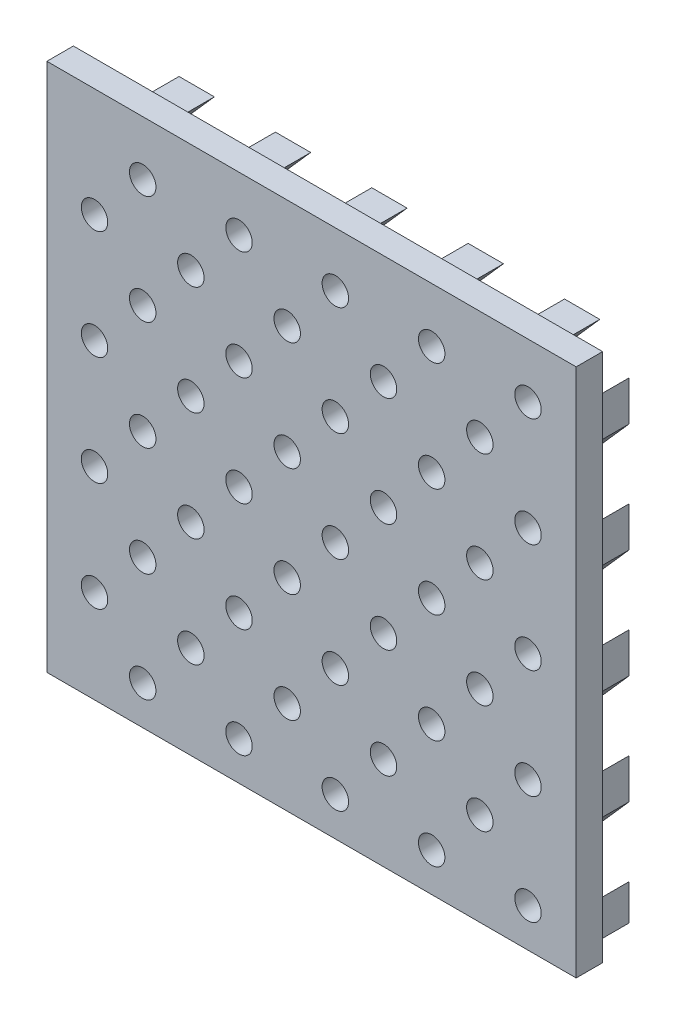
from build123d import *

# Parameters (mm, degrees)
SKETCH1_W                  = 200
SKETCH1_H                  = 200
BOSS_EXTRUDE1_DEPTH        = 5
SKETCH2_R                  = 2.5
CUT_EXTRUDE2_DEPTH         = 5
LPATTERN1_COUNT            = 10
LPATTERN1_PITCH            = 18.2
SKETCH3_R                  = 2.5
CUT_EXTRUDE3_DEPTH         = 5
LPATTERN3_COUNT            = 10
LPATTERN3_PITCH            = 20.6
LPATTERN3_COPY_1_SKETCH_R  = 2.5
LPATTERN3_COPY_1_DEPTH     = 5
LPATTERN3_COPY_2_SKETCH_R  = 2.5
LPATTERN3_COPY_2_DEPTH     = 5
LPATTERN3_COPY_3_SKETCH_R  = 2.5
LPATTERN3_COPY_3_DEPTH     = 5
LPATTERN3_COPY_4_SKETCH_R  = 2.5
LPATTERN3_COPY_4_DEPTH     = 5
LPATTERN3_COPY_5_SKETCH_R  = 2.5
LPATTERN3_COPY_5_DEPTH     = 5
LPATTERN3_COPY_6_SKETCH_R  = 2.5
LPATTERN3_COPY_6_DEPTH     = 5
LPATTERN3_COPY_7_SKETCH_R  = 2.5
LPATTERN3_COPY_7_DEPTH     = 5
LPATTERN3_COPY_8_SKETCH_R  = 2.5
LPATTERN3_COPY_8_DEPTH     = 5
LPATTERN3_COPY_9_SKETCH_R  = 2.5
LPATTERN3_COPY_9_DEPTH     = 5
LPATTERN3_COPY_10_SKETCH_R = 2.5
LPATTERN3_COPY_10_DEPTH    = 5
LPATTERN3_COPY_11_SKETCH_R = 2.5
LPATTERN3_COPY_11_DEPTH    = 5
LPATTERN3_COPY_12_SKETCH_R = 2.5
LPATTERN3_COPY_12_DEPTH    = 5
LPATTERN3_COPY_13_SKETCH_R = 2.5
LPATTERN3_COPY_13_DEPTH    = 5
LPATTERN3_COPY_14_SKETCH_R = 2.5
LPATTERN3_COPY_14_DEPTH    = 5
LPATTERN3_COPY_15_SKETCH_R = 2.5
LPATTERN3_COPY_15_DEPTH    = 5
LPATTERN3_COPY_16_SKETCH_R = 2.5
LPATTERN3_COPY_16_DEPTH    = 5
LPATTERN3_COPY_17_SKETCH_R = 2.5
LPATTERN3_COPY_17_DEPTH    = 5
LPATTERN3_COPY_18_SKETCH_R = 2.5
LPATTERN3_COPY_18_DEPTH    = 5
LPATTERN3_COPY_19_SKETCH_R = 2.5
LPATTERN3_COPY_19_DEPTH    = 5
LPATTERN3_COPY_20_SKETCH_R = 2.5
LPATTERN3_COPY_20_DEPTH    = 5
LPATTERN3_COPY_21_SKETCH_R = 2.5
LPATTERN3_COPY_21_DEPTH    = 5
LPATTERN3_COPY_22_SKETCH_R = 2.5
LPATTERN3_COPY_22_DEPTH    = 5
LPATTERN3_COPY_23_SKETCH_R = 2.5
LPATTERN3_COPY_23_DEPTH    = 5
LPATTERN3_COPY_24_SKETCH_R = 2.5
LPATTERN3_COPY_24_DEPTH    = 5
LPATTERN3_COPY_25_SKETCH_R = 2.5
LPATTERN3_COPY_25_DEPTH    = 5
LPATTERN3_COPY_26_SKETCH_R = 2.5
LPATTERN3_COPY_26_DEPTH    = 5
LPATTERN3_COPY_27_SKETCH_R = 2.5
LPATTERN3_COPY_27_DEPTH    = 5
LPATTERN3_COPY_28_SKETCH_R = 2.5
LPATTERN3_COPY_28_DEPTH    = 5
LPATTERN3_COPY_29_SKETCH_R = 2.5
LPATTERN3_COPY_29_DEPTH    = 5
LPATTERN3_COPY_30_SKETCH_R = 2.5
LPATTERN3_COPY_30_DEPTH    = 5
LPATTERN3_COPY_31_SKETCH_R = 2.5
LPATTERN3_COPY_31_DEPTH    = 5
LPATTERN3_COPY_32_SKETCH_R = 2.5
LPATTERN3_COPY_32_DEPTH    = 5
LPATTERN3_COPY_33_SKETCH_R = 2.5
LPATTERN3_COPY_33_DEPTH    = 5
LPATTERN3_COPY_34_SKETCH_R = 2.5
LPATTERN3_COPY_34_DEPTH    = 5
LPATTERN3_COPY_35_SKETCH_R = 2.5
LPATTERN3_COPY_35_DEPTH    = 5
LPATTERN3_COPY_36_SKETCH_R = 2.5
LPATTERN3_COPY_36_DEPTH    = 5
LPATTERN3_COPY_37_SKETCH_R = 2.5
LPATTERN3_COPY_37_DEPTH    = 5
LPATTERN3_COPY_38_SKETCH_R = 2.5
LPATTERN3_COPY_38_DEPTH    = 5
LPATTERN3_COPY_39_SKETCH_R = 2.5
LPATTERN3_COPY_39_DEPTH    = 5
LPATTERN3_COPY_40_SKETCH_R = 2.5
LPATTERN3_COPY_40_DEPTH    = 5
LPATTERN3_COPY_41_SKETCH_R = 2.5
LPATTERN3_COPY_41_DEPTH    = 5
LPATTERN3_COPY_42_SKETCH_R = 2.5
LPATTERN3_COPY_42_DEPTH    = 5
LPATTERN3_COPY_43_SKETCH_R = 2.5
LPATTERN3_COPY_43_DEPTH    = 5
LPATTERN3_COPY_44_SKETCH_R = 2.5
LPATTERN3_COPY_44_DEPTH    = 5
LPATTERN3_COPY_45_SKETCH_R = 2.5
LPATTERN3_COPY_45_DEPTH    = 5
LPATTERN3_COPY_46_SKETCH_R = 2.5
LPATTERN3_COPY_46_DEPTH    = 5
LPATTERN3_COPY_47_SKETCH_R = 2.5
LPATTERN3_COPY_47_DEPTH    = 5
LPATTERN3_COPY_48_SKETCH_R = 2.5
LPATTERN3_COPY_48_DEPTH    = 5
LPATTERN3_COPY_49_SKETCH_R = 2.5
LPATTERN3_COPY_49_DEPTH    = 5
LPATTERN3_COPY_50_SKETCH_R = 2.5
LPATTERN3_COPY_50_DEPTH    = 5
LPATTERN3_COPY_51_SKETCH_R = 2.5
LPATTERN3_COPY_51_DEPTH    = 5
LPATTERN3_COPY_52_SKETCH_R = 2.5
LPATTERN3_COPY_52_DEPTH    = 5
LPATTERN3_COPY_53_SKETCH_R = 2.5
LPATTERN3_COPY_53_DEPTH    = 5
LPATTERN3_COPY_54_SKETCH_R = 2.5
LPATTERN3_COPY_54_DEPTH    = 5
LPATTERN3_COPY_55_SKETCH_R = 2.5
LPATTERN3_COPY_55_DEPTH    = 5
LPATTERN3_COPY_56_SKETCH_R = 2.5
LPATTERN3_COPY_56_DEPTH    = 5
LPATTERN3_COPY_57_SKETCH_R = 2.5
LPATTERN3_COPY_57_DEPTH    = 5
LPATTERN3_COPY_58_SKETCH_R = 2.5
LPATTERN3_COPY_58_DEPTH    = 5
LPATTERN3_COPY_59_SKETCH_R = 2.5
LPATTERN3_COPY_59_DEPTH    = 5
LPATTERN3_COPY_60_SKETCH_R = 2.5
LPATTERN3_COPY_60_DEPTH    = 5
LPATTERN3_COPY_61_SKETCH_R = 2.5
LPATTERN3_COPY_61_DEPTH    = 5
LPATTERN3_COPY_62_SKETCH_R = 2.5
LPATTERN3_COPY_62_DEPTH    = 5
LPATTERN3_COPY_63_SKETCH_R = 2.5
LPATTERN3_COPY_63_DEPTH    = 5
LPATTERN3_COPY_64_SKETCH_R = 2.5
LPATTERN3_COPY_64_DEPTH    = 5
LPATTERN3_COPY_65_SKETCH_R = 2.5
LPATTERN3_COPY_65_DEPTH    = 5
LPATTERN3_COPY_66_SKETCH_R = 2.5
LPATTERN3_COPY_66_DEPTH    = 5
LPATTERN3_COPY_67_SKETCH_R = 2.5
LPATTERN3_COPY_67_DEPTH    = 5
LPATTERN3_COPY_68_SKETCH_R = 2.5
LPATTERN3_COPY_68_DEPTH    = 5
LPATTERN3_COPY_69_SKETCH_R = 2.5
LPATTERN3_COPY_69_DEPTH    = 5
LPATTERN3_COPY_70_SKETCH_R = 2.5
LPATTERN3_COPY_70_DEPTH    = 5
LPATTERN3_COPY_71_SKETCH_R = 2.5
LPATTERN3_COPY_71_DEPTH    = 5
LPATTERN3_COPY_72_SKETCH_R = 2.5
LPATTERN3_COPY_72_DEPTH    = 5
LPATTERN3_COPY_73_SKETCH_R = 2.5
LPATTERN3_COPY_73_DEPTH    = 5
LPATTERN3_COPY_74_SKETCH_R = 2.5
LPATTERN3_COPY_74_DEPTH    = 5
LPATTERN3_COPY_75_SKETCH_R = 2.5
LPATTERN3_COPY_75_DEPTH    = 5
LPATTERN3_COPY_76_SKETCH_R = 2.5
LPATTERN3_COPY_76_DEPTH    = 5
LPATTERN3_COPY_77_SKETCH_R = 2.5
LPATTERN3_COPY_77_DEPTH    = 5
LPATTERN3_COPY_78_SKETCH_R = 2.5
LPATTERN3_COPY_78_DEPTH    = 5
LPATTERN3_COPY_79_SKETCH_R = 2.5
LPATTERN3_COPY_79_DEPTH    = 5
LPATTERN3_COPY_80_SKETCH_R = 2.5
LPATTERN3_COPY_80_DEPTH    = 5
LPATTERN3_COPY_81_SKETCH_R = 2.5
LPATTERN3_COPY_81_DEPTH    = 5
LPATTERN3_COPY_82_SKETCH_R = 2.5
LPATTERN3_COPY_82_DEPTH    = 5
LPATTERN3_COPY_83_SKETCH_R = 2.5
LPATTERN3_COPY_83_DEPTH    = 5
LPATTERN3_COPY_84_SKETCH_R = 2.5
LPATTERN3_COPY_84_DEPTH    = 5
LPATTERN3_COPY_85_SKETCH_R = 2.5
LPATTERN3_COPY_85_DEPTH    = 5
LPATTERN3_COPY_86_SKETCH_R = 2.5
LPATTERN3_COPY_86_DEPTH    = 5
LPATTERN3_COPY_87_SKETCH_R = 2.5
LPATTERN3_COPY_87_DEPTH    = 5
LPATTERN3_COPY_88_SKETCH_R = 2.5
LPATTERN3_COPY_88_DEPTH    = 5
LPATTERN3_COPY_89_SKETCH_R = 2.5
LPATTERN3_COPY_89_DEPTH    = 5
LPATTERN3_COPY_90_SKETCH_R = 2.5
LPATTERN3_COPY_90_DEPTH    = 5
BOSS_EXTRUDE2_DEPTH        = 7
LPATTERN4_COUNT            = 11
LPATTERN4_PITCH            = 13.75
LPATTERN5_COPY_1_DEPTH     = 7
LPATTERN5_COPY_2_DEPTH     = 7
LPATTERN5_COPY_3_DEPTH     = 7
LPATTERN5_COPY_4_DEPTH     = 7
LPATTERN5_COPY_5_DEPTH     = 7
LPATTERN5_COPY_6_DEPTH     = 7
LPATTERN5_COPY_7_DEPTH     = 7
LPATTERN5_COPY_8_DEPTH     = 7
LPATTERN5_COPY_9_DEPTH     = 7
LPATTERN5_COPY_10_DEPTH    = 7
LPATTERN5_COPY_11_DEPTH    = 7
LPATTERN5_COPY_12_DEPTH    = 7
LPATTERN5_COPY_13_DEPTH    = 7
LPATTERN5_COPY_14_DEPTH    = 7
LPATTERN5_COPY_15_DEPTH    = 7
LPATTERN5_COPY_16_DEPTH    = 7
LPATTERN5_COPY_17_DEPTH    = 7
LPATTERN5_COPY_18_DEPTH    = 7
LPATTERN5_COPY_19_DEPTH    = 7
LPATTERN5_COPY_20_DEPTH    = 7
LPATTERN5_COPY_21_DEPTH    = 7
LPATTERN5_COPY_22_DEPTH    = 7
LPATTERN5_COPY_23_DEPTH    = 7
LPATTERN5_COPY_24_DEPTH    = 7
LPATTERN5_COPY_25_DEPTH    = 7
LPATTERN5_COPY_26_DEPTH    = 7
LPATTERN5_COPY_27_DEPTH    = 7
LPATTERN5_COPY_28_DEPTH    = 7
LPATTERN5_COPY_29_DEPTH    = 7
LPATTERN5_COPY_30_DEPTH    = 7
LPATTERN5_COPY_31_DEPTH    = 7
LPATTERN5_COPY_32_DEPTH    = 7
LPATTERN5_COPY_33_DEPTH    = 7
LPATTERN5_COPY_34_DEPTH    = 7
LPATTERN5_COPY_35_DEPTH    = 7
LPATTERN5_COPY_36_DEPTH    = 7
LPATTERN5_COPY_37_DEPTH    = 7
LPATTERN5_COPY_38_DEPTH    = 7
LPATTERN5_COPY_39_DEPTH    = 7
LPATTERN5_COPY_40_DEPTH    = 7
LPATTERN5_COPY_41_DEPTH    = 7
LPATTERN5_COPY_42_DEPTH    = 7
LPATTERN5_COPY_43_DEPTH    = 7
LPATTERN5_COPY_44_DEPTH    = 7
LPATTERN5_COPY_45_DEPTH    = 7
LPATTERN5_COPY_46_DEPTH    = 7
LPATTERN5_COPY_47_DEPTH    = 7
LPATTERN5_COPY_48_DEPTH    = 7
LPATTERN5_COPY_49_DEPTH    = 7
LPATTERN5_COPY_50_DEPTH    = 7
LPATTERN5_COPY_51_DEPTH    = 7
LPATTERN5_COPY_52_DEPTH    = 7
LPATTERN5_COPY_53_DEPTH    = 7
LPATTERN5_COPY_54_DEPTH    = 7
LPATTERN5_COPY_55_DEPTH    = 7
LPATTERN5_COPY_56_DEPTH    = 7
LPATTERN5_COPY_57_DEPTH    = 7
LPATTERN5_COPY_58_DEPTH    = 7
LPATTERN5_COPY_59_DEPTH    = 7
LPATTERN5_COPY_60_DEPTH    = 7
LPATTERN5_COPY_61_DEPTH    = 7
LPATTERN5_COPY_62_DEPTH    = 7
LPATTERN5_COPY_63_DEPTH    = 7
LPATTERN5_COPY_64_DEPTH    = 7
LPATTERN5_COPY_65_DEPTH    = 7
LPATTERN5_COPY_66_DEPTH    = 7
LPATTERN5_COPY_67_DEPTH    = 7
LPATTERN5_COPY_68_DEPTH    = 7
LPATTERN5_COPY_69_DEPTH    = 7
LPATTERN5_COPY_70_DEPTH    = 7
LPATTERN5_COPY_71_DEPTH    = 7
LPATTERN5_COPY_72_DEPTH    = 7
LPATTERN5_COPY_73_DEPTH    = 7
LPATTERN5_COPY_74_DEPTH    = 7
LPATTERN5_COPY_75_DEPTH    = 7
LPATTERN5_COPY_76_DEPTH    = 7
LPATTERN5_COPY_77_DEPTH    = 7
LPATTERN5_COPY_78_DEPTH    = 7
LPATTERN5_COPY_79_DEPTH    = 7
LPATTERN5_COPY_80_DEPTH    = 7
LPATTERN5_COPY_81_DEPTH    = 7
LPATTERN5_COPY_82_DEPTH    = 7
LPATTERN5_COPY_83_DEPTH    = 7
LPATTERN5_COPY_84_DEPTH    = 7
LPATTERN5_COPY_85_DEPTH    = 7
LPATTERN5_COPY_86_DEPTH    = 7
LPATTERN5_COPY_87_DEPTH    = 7
LPATTERN5_COPY_88_DEPTH    = 7
LPATTERN5_COPY_89_DEPTH    = 7
LPATTERN5_COPY_90_DEPTH    = 7
LPATTERN5_COPY_91_DEPTH    = 7
LPATTERN5_COPY_92_DEPTH    = 7
LPATTERN5_COPY_93_DEPTH    = 7
LPATTERN5_COPY_94_DEPTH    = 7
LPATTERN5_COPY_95_DEPTH    = 7
LPATTERN5_COPY_96_DEPTH    = 7
LPATTERN5_COPY_97_DEPTH    = 7
LPATTERN5_COPY_98_DEPTH    = 7
LPATTERN5_COPY_99_DEPTH    = 7
LPATTERN5_COPY_100_DEPTH   = 7
LPATTERN5_COPY_101_DEPTH   = 7
LPATTERN5_COPY_102_DEPTH   = 7
LPATTERN5_COPY_103_DEPTH   = 7
LPATTERN5_COPY_104_DEPTH   = 7
LPATTERN5_COPY_105_DEPTH   = 7
LPATTERN5_COPY_106_DEPTH   = 7
LPATTERN5_COPY_107_DEPTH   = 7
LPATTERN5_COPY_108_DEPTH   = 7
LPATTERN5_COPY_109_DEPTH   = 7
LPATTERN5_COPY_110_DEPTH   = 7
CUT_EXTRUDE4_DEPTH         = 297.02362896
CUT_EXTRUDE4_DEPTH_BACK    = 297.02362896
SKETCH7_W                  = 113.24148287
SKETCH7_H                  = 226.134626883
CUT_EXTRUDE5_DEPTH         = 292.879866722
CUT_EXTRUDE5_DEPTH_BACK    = 292.879866722
SKETCH8_W                  = 219.609237939
SKETCH8_H                  = 130.908931437
CUT_EXTRUDE6_DEPTH         = 283.104017521
CUT_EXTRUDE6_DEPTH_BACK    = 283.104017521
SKETCH9_W                  = 115.70679857
SKETCH9_H                  = 218.536743587
CUT_EXTRUDE7_DEPTH         = 233.673524783
CUT_EXTRUDE7_DEPTH_BACK    = 233.673524783
SKETCH10_W                 = 225.718699954
SKETCH10_H                 = 118.907997975
CUT_EXTRUDE8_DEPTH         = 142.594491418
SKETCH12_W                 = 2
SKETCH12_H                 = 201.79010582
CUT_EXTRUDE13_DEPTH        = 142.594491418
SKETCH14_W                 = 208.579726071
SKETCH14_H                 = 2
CUT_EXTRUDE15_DEPTH        = 142.594491418
SKETCH15_W                 = 2
SKETCH15_H                 = 213.589051887
CUT_EXTRUDE16_DEPTH        = 142.594491418
CUT_EXTRUDE17_DEPTH        = 142.594491418
CUT_EXTRUDE17_DEPTH_BACK   = 142.594491418
SKETCH17_W                 = 2.513620771
SKETCH17_H                 = 89.628971858
BOSS_EXTRUDE3_DEPTH        = 5
SKETCH20_W                 = 2
SKETCH20_H                 = 100
CUT_EXTRUDE18_DEPTH        = 7
SKETCH21_W                 = 97.422058514
SKETCH21_H                 = 2
CUT_EXTRUDE19_DEPTH        = 7


with BuildPart() as part:
    # Sketch1 → Boss-Extrude1 (new body)
    with BuildSketch(Plane.XY):
        Rectangle(SKETCH1_W, SKETCH1_H)
    extrude(amount=BOSS_EXTRUDE1_DEPTH)

    # Sketch2 → Cut-Extrude2 (cut)
    with BuildSketch(Plane(origin=(0, 0, 0), x_dir=(-1, 0, 0), z_dir=(0, 0, -1))):
        with Locations((-90.9, 89.7)):
            Circle(SKETCH2_R)
        with Locations((-81.8, 79.4)):
            Circle(SKETCH2_R)
    cut_extrude2 = extrude(amount=-CUT_EXTRUDE2_DEPTH, mode=Mode.SUBTRACT)

    # LPattern1: Cut-Extrude2 ×10
    with Locations(*[(-i * LPATTERN1_PITCH, 0, 0) for i in range(1, LPATTERN1_COUNT)]):
        add(cut_extrude2, mode=Mode.SUBTRACT)

    # Sketch3 → Cut-Extrude3 (cut)
    with BuildSketch(Plane(origin=(0, 0, 0), x_dir=(-1, 0, 0), z_dir=(0, 0, -1))):
        with Locations((91.1, 89.7)):
            Circle(SKETCH3_R)
    cut_extrude3 = extrude(amount=-CUT_EXTRUDE3_DEPTH, mode=Mode.SUBTRACT)

    # LPattern3: Cut-Extrude3 ×10
    with Locations(*[(0, -i * LPATTERN3_PITCH, 0) for i in range(1, LPATTERN3_COUNT)]):
        add(cut_extrude3, mode=Mode.SUBTRACT)

    # LPattern3 copy 1 sketch → LPattern3 copy 1 (cut)
    with BuildSketch(Plane(origin=(-18.2, -20.6, 0), x_dir=(-1, 0, 0), z_dir=(0, 0, -1))):
        with Locations((-90.9, 89.7)):
            Circle(LPATTERN3_COPY_1_SKETCH_R)
        with Locations((-81.8, 79.4)):
            Circle(LPATTERN3_COPY_1_SKETCH_R)
    extrude(amount=-LPATTERN3_COPY_1_DEPTH, mode=Mode.SUBTRACT)

    # LPattern3 copy 2 sketch → LPattern3 copy 2 (cut)
    with BuildSketch(Plane(origin=(-18.2, -41.2, 0), x_dir=(-1, 0, 0), z_dir=(0, 0, -1))):
        with Locations((-90.9, 89.7)):
            Circle(LPATTERN3_COPY_2_SKETCH_R)
        with Locations((-81.8, 79.4)):
            Circle(LPATTERN3_COPY_2_SKETCH_R)
    extrude(amount=-LPATTERN3_COPY_2_DEPTH, mode=Mode.SUBTRACT)

    # LPattern3 copy 3 sketch → LPattern3 copy 3 (cut)
    with BuildSketch(Plane(origin=(-18.2, -61.8, 0), x_dir=(-1, 0, 0), z_dir=(0, 0, -1))):
        with Locations((-90.9, 89.7)):
            Circle(LPATTERN3_COPY_3_SKETCH_R)
        with Locations((-81.8, 79.4)):
            Circle(LPATTERN3_COPY_3_SKETCH_R)
    extrude(amount=-LPATTERN3_COPY_3_DEPTH, mode=Mode.SUBTRACT)

    # LPattern3 copy 4 sketch → LPattern3 copy 4 (cut)
    with BuildSketch(Plane(origin=(-18.2, -82.4, 0), x_dir=(-1, 0, 0), z_dir=(0, 0, -1))):
        with Locations((-90.9, 89.7)):
            Circle(LPATTERN3_COPY_4_SKETCH_R)
        with Locations((-81.8, 79.4)):
            Circle(LPATTERN3_COPY_4_SKETCH_R)
    extrude(amount=-LPATTERN3_COPY_4_DEPTH, mode=Mode.SUBTRACT)

    # LPattern3 copy 5 sketch → LPattern3 copy 5 (cut)
    with BuildSketch(Plane(origin=(-18.2, -103, 0), x_dir=(-1, 0, 0), z_dir=(0, 0, -1))):
        with Locations((-90.9, 89.7)):
            Circle(LPATTERN3_COPY_5_SKETCH_R)
        with Locations((-81.8, 79.4)):
            Circle(LPATTERN3_COPY_5_SKETCH_R)
    extrude(amount=-LPATTERN3_COPY_5_DEPTH, mode=Mode.SUBTRACT)

    # LPattern3 copy 6 sketch → LPattern3 copy 6 (cut)
    with BuildSketch(Plane(origin=(-18.2, -123.6, 0), x_dir=(-1, 0, 0), z_dir=(0, 0, -1))):
        with Locations((-90.9, 89.7)):
            Circle(LPATTERN3_COPY_6_SKETCH_R)
        with Locations((-81.8, 79.4)):
            Circle(LPATTERN3_COPY_6_SKETCH_R)
    extrude(amount=-LPATTERN3_COPY_6_DEPTH, mode=Mode.SUBTRACT)

    # LPattern3 copy 7 sketch → LPattern3 copy 7 (cut)
    with BuildSketch(Plane(origin=(-18.2, -144.2, 0), x_dir=(-1, 0, 0), z_dir=(0, 0, -1))):
        with Locations((-90.9, 89.7)):
            Circle(LPATTERN3_COPY_7_SKETCH_R)
        with Locations((-81.8, 79.4)):
            Circle(LPATTERN3_COPY_7_SKETCH_R)
    extrude(amount=-LPATTERN3_COPY_7_DEPTH, mode=Mode.SUBTRACT)

    # LPattern3 copy 8 sketch → LPattern3 copy 8 (cut)
    with BuildSketch(Plane(origin=(-18.2, -164.8, 0), x_dir=(-1, 0, 0), z_dir=(0, 0, -1))):
        with Locations((-90.9, 89.7)):
            Circle(LPATTERN3_COPY_8_SKETCH_R)
        with Locations((-81.8, 79.4)):
            Circle(LPATTERN3_COPY_8_SKETCH_R)
    extrude(amount=-LPATTERN3_COPY_8_DEPTH, mode=Mode.SUBTRACT)

    # LPattern3 copy 9 sketch → LPattern3 copy 9 (cut)
    with BuildSketch(Plane(origin=(-18.2, -185.4, 0), x_dir=(-1, 0, 0), z_dir=(0, 0, -1))):
        with Locations((-90.9, 89.7)):
            Circle(LPATTERN3_COPY_9_SKETCH_R)
        with Locations((-81.8, 79.4)):
            Circle(LPATTERN3_COPY_9_SKETCH_R)
    extrude(amount=-LPATTERN3_COPY_9_DEPTH, mode=Mode.SUBTRACT)

    # LPattern3 copy 10 sketch → LPattern3 copy 10 (cut)
    with BuildSketch(Plane(origin=(-36.4, -20.6, 0), x_dir=(-1, 0, 0), z_dir=(0, 0, -1))):
        with Locations((-90.9, 89.7)):
            Circle(LPATTERN3_COPY_10_SKETCH_R)
        with Locations((-81.8, 79.4)):
            Circle(LPATTERN3_COPY_10_SKETCH_R)
    extrude(amount=-LPATTERN3_COPY_10_DEPTH, mode=Mode.SUBTRACT)

    # LPattern3 copy 11 sketch → LPattern3 copy 11 (cut)
    with BuildSketch(Plane(origin=(-36.4, -41.2, 0), x_dir=(-1, 0, 0), z_dir=(0, 0, -1))):
        with Locations((-90.9, 89.7)):
            Circle(LPATTERN3_COPY_11_SKETCH_R)
        with Locations((-81.8, 79.4)):
            Circle(LPATTERN3_COPY_11_SKETCH_R)
    extrude(amount=-LPATTERN3_COPY_11_DEPTH, mode=Mode.SUBTRACT)

    # LPattern3 copy 12 sketch → LPattern3 copy 12 (cut)
    with BuildSketch(Plane(origin=(-36.4, -61.8, 0), x_dir=(-1, 0, 0), z_dir=(0, 0, -1))):
        with Locations((-90.9, 89.7)):
            Circle(LPATTERN3_COPY_12_SKETCH_R)
        with Locations((-81.8, 79.4)):
            Circle(LPATTERN3_COPY_12_SKETCH_R)
    extrude(amount=-LPATTERN3_COPY_12_DEPTH, mode=Mode.SUBTRACT)

    # LPattern3 copy 13 sketch → LPattern3 copy 13 (cut)
    with BuildSketch(Plane(origin=(-36.4, -82.4, 0), x_dir=(-1, 0, 0), z_dir=(0, 0, -1))):
        with Locations((-90.9, 89.7)):
            Circle(LPATTERN3_COPY_13_SKETCH_R)
        with Locations((-81.8, 79.4)):
            Circle(LPATTERN3_COPY_13_SKETCH_R)
    extrude(amount=-LPATTERN3_COPY_13_DEPTH, mode=Mode.SUBTRACT)

    # LPattern3 copy 14 sketch → LPattern3 copy 14 (cut)
    with BuildSketch(Plane(origin=(-36.4, -103, 0), x_dir=(-1, 0, 0), z_dir=(0, 0, -1))):
        with Locations((-90.9, 89.7)):
            Circle(LPATTERN3_COPY_14_SKETCH_R)
        with Locations((-81.8, 79.4)):
            Circle(LPATTERN3_COPY_14_SKETCH_R)
    extrude(amount=-LPATTERN3_COPY_14_DEPTH, mode=Mode.SUBTRACT)

    # LPattern3 copy 15 sketch → LPattern3 copy 15 (cut)
    with BuildSketch(Plane(origin=(-36.4, -123.6, 0), x_dir=(-1, 0, 0), z_dir=(0, 0, -1))):
        with Locations((-90.9, 89.7)):
            Circle(LPATTERN3_COPY_15_SKETCH_R)
        with Locations((-81.8, 79.4)):
            Circle(LPATTERN3_COPY_15_SKETCH_R)
    extrude(amount=-LPATTERN3_COPY_15_DEPTH, mode=Mode.SUBTRACT)

    # LPattern3 copy 16 sketch → LPattern3 copy 16 (cut)
    with BuildSketch(Plane(origin=(-36.4, -144.2, 0), x_dir=(-1, 0, 0), z_dir=(0, 0, -1))):
        with Locations((-90.9, 89.7)):
            Circle(LPATTERN3_COPY_16_SKETCH_R)
        with Locations((-81.8, 79.4)):
            Circle(LPATTERN3_COPY_16_SKETCH_R)
    extrude(amount=-LPATTERN3_COPY_16_DEPTH, mode=Mode.SUBTRACT)

    # LPattern3 copy 17 sketch → LPattern3 copy 17 (cut)
    with BuildSketch(Plane(origin=(-36.4, -164.8, 0), x_dir=(-1, 0, 0), z_dir=(0, 0, -1))):
        with Locations((-90.9, 89.7)):
            Circle(LPATTERN3_COPY_17_SKETCH_R)
        with Locations((-81.8, 79.4)):
            Circle(LPATTERN3_COPY_17_SKETCH_R)
    extrude(amount=-LPATTERN3_COPY_17_DEPTH, mode=Mode.SUBTRACT)

    # LPattern3 copy 18 sketch → LPattern3 copy 18 (cut)
    with BuildSketch(Plane(origin=(-36.4, -185.4, 0), x_dir=(-1, 0, 0), z_dir=(0, 0, -1))):
        with Locations((-90.9, 89.7)):
            Circle(LPATTERN3_COPY_18_SKETCH_R)
        with Locations((-81.8, 79.4)):
            Circle(LPATTERN3_COPY_18_SKETCH_R)
    extrude(amount=-LPATTERN3_COPY_18_DEPTH, mode=Mode.SUBTRACT)

    # LPattern3 copy 19 sketch → LPattern3 copy 19 (cut)
    with BuildSketch(Plane(origin=(-54.6, -20.6, 0), x_dir=(-1, 0, 0), z_dir=(0, 0, -1))):
        with Locations((-90.9, 89.7)):
            Circle(LPATTERN3_COPY_19_SKETCH_R)
        with Locations((-81.8, 79.4)):
            Circle(LPATTERN3_COPY_19_SKETCH_R)
    extrude(amount=-LPATTERN3_COPY_19_DEPTH, mode=Mode.SUBTRACT)

    # LPattern3 copy 20 sketch → LPattern3 copy 20 (cut)
    with BuildSketch(Plane(origin=(-54.6, -41.2, 0), x_dir=(-1, 0, 0), z_dir=(0, 0, -1))):
        with Locations((-90.9, 89.7)):
            Circle(LPATTERN3_COPY_20_SKETCH_R)
        with Locations((-81.8, 79.4)):
            Circle(LPATTERN3_COPY_20_SKETCH_R)
    extrude(amount=-LPATTERN3_COPY_20_DEPTH, mode=Mode.SUBTRACT)

    # LPattern3 copy 21 sketch → LPattern3 copy 21 (cut)
    with BuildSketch(Plane(origin=(-54.6, -61.8, 0), x_dir=(-1, 0, 0), z_dir=(0, 0, -1))):
        with Locations((-90.9, 89.7)):
            Circle(LPATTERN3_COPY_21_SKETCH_R)
        with Locations((-81.8, 79.4)):
            Circle(LPATTERN3_COPY_21_SKETCH_R)
    extrude(amount=-LPATTERN3_COPY_21_DEPTH, mode=Mode.SUBTRACT)

    # LPattern3 copy 22 sketch → LPattern3 copy 22 (cut)
    with BuildSketch(Plane(origin=(-54.6, -82.4, 0), x_dir=(-1, 0, 0), z_dir=(0, 0, -1))):
        with Locations((-90.9, 89.7)):
            Circle(LPATTERN3_COPY_22_SKETCH_R)
        with Locations((-81.8, 79.4)):
            Circle(LPATTERN3_COPY_22_SKETCH_R)
    extrude(amount=-LPATTERN3_COPY_22_DEPTH, mode=Mode.SUBTRACT)

    # LPattern3 copy 23 sketch → LPattern3 copy 23 (cut)
    with BuildSketch(Plane(origin=(-54.6, -103, 0), x_dir=(-1, 0, 0), z_dir=(0, 0, -1))):
        with Locations((-90.9, 89.7)):
            Circle(LPATTERN3_COPY_23_SKETCH_R)
        with Locations((-81.8, 79.4)):
            Circle(LPATTERN3_COPY_23_SKETCH_R)
    extrude(amount=-LPATTERN3_COPY_23_DEPTH, mode=Mode.SUBTRACT)

    # LPattern3 copy 24 sketch → LPattern3 copy 24 (cut)
    with BuildSketch(Plane(origin=(-54.6, -123.6, 0), x_dir=(-1, 0, 0), z_dir=(0, 0, -1))):
        with Locations((-90.9, 89.7)):
            Circle(LPATTERN3_COPY_24_SKETCH_R)
        with Locations((-81.8, 79.4)):
            Circle(LPATTERN3_COPY_24_SKETCH_R)
    extrude(amount=-LPATTERN3_COPY_24_DEPTH, mode=Mode.SUBTRACT)

    # LPattern3 copy 25 sketch → LPattern3 copy 25 (cut)
    with BuildSketch(Plane(origin=(-54.6, -144.2, 0), x_dir=(-1, 0, 0), z_dir=(0, 0, -1))):
        with Locations((-90.9, 89.7)):
            Circle(LPATTERN3_COPY_25_SKETCH_R)
        with Locations((-81.8, 79.4)):
            Circle(LPATTERN3_COPY_25_SKETCH_R)
    extrude(amount=-LPATTERN3_COPY_25_DEPTH, mode=Mode.SUBTRACT)

    # LPattern3 copy 26 sketch → LPattern3 copy 26 (cut)
    with BuildSketch(Plane(origin=(-54.6, -164.8, 0), x_dir=(-1, 0, 0), z_dir=(0, 0, -1))):
        with Locations((-90.9, 89.7)):
            Circle(LPATTERN3_COPY_26_SKETCH_R)
        with Locations((-81.8, 79.4)):
            Circle(LPATTERN3_COPY_26_SKETCH_R)
    extrude(amount=-LPATTERN3_COPY_26_DEPTH, mode=Mode.SUBTRACT)

    # LPattern3 copy 27 sketch → LPattern3 copy 27 (cut)
    with BuildSketch(Plane(origin=(-54.6, -185.4, 0), x_dir=(-1, 0, 0), z_dir=(0, 0, -1))):
        with Locations((-90.9, 89.7)):
            Circle(LPATTERN3_COPY_27_SKETCH_R)
        with Locations((-81.8, 79.4)):
            Circle(LPATTERN3_COPY_27_SKETCH_R)
    extrude(amount=-LPATTERN3_COPY_27_DEPTH, mode=Mode.SUBTRACT)

    # LPattern3 copy 28 sketch → LPattern3 copy 28 (cut)
    with BuildSketch(Plane(origin=(-72.8, -20.6, 0), x_dir=(-1, 0, 0), z_dir=(0, 0, -1))):
        with Locations((-90.9, 89.7)):
            Circle(LPATTERN3_COPY_28_SKETCH_R)
        with Locations((-81.8, 79.4)):
            Circle(LPATTERN3_COPY_28_SKETCH_R)
    extrude(amount=-LPATTERN3_COPY_28_DEPTH, mode=Mode.SUBTRACT)

    # LPattern3 copy 29 sketch → LPattern3 copy 29 (cut)
    with BuildSketch(Plane(origin=(-72.8, -41.2, 0), x_dir=(-1, 0, 0), z_dir=(0, 0, -1))):
        with Locations((-90.9, 89.7)):
            Circle(LPATTERN3_COPY_29_SKETCH_R)
        with Locations((-81.8, 79.4)):
            Circle(LPATTERN3_COPY_29_SKETCH_R)
    extrude(amount=-LPATTERN3_COPY_29_DEPTH, mode=Mode.SUBTRACT)

    # LPattern3 copy 30 sketch → LPattern3 copy 30 (cut)
    with BuildSketch(Plane(origin=(-72.8, -61.8, 0), x_dir=(-1, 0, 0), z_dir=(0, 0, -1))):
        with Locations((-90.9, 89.7)):
            Circle(LPATTERN3_COPY_30_SKETCH_R)
        with Locations((-81.8, 79.4)):
            Circle(LPATTERN3_COPY_30_SKETCH_R)
    extrude(amount=-LPATTERN3_COPY_30_DEPTH, mode=Mode.SUBTRACT)

    # LPattern3 copy 31 sketch → LPattern3 copy 31 (cut)
    with BuildSketch(Plane(origin=(-72.8, -82.4, 0), x_dir=(-1, 0, 0), z_dir=(0, 0, -1))):
        with Locations((-90.9, 89.7)):
            Circle(LPATTERN3_COPY_31_SKETCH_R)
        with Locations((-81.8, 79.4)):
            Circle(LPATTERN3_COPY_31_SKETCH_R)
    extrude(amount=-LPATTERN3_COPY_31_DEPTH, mode=Mode.SUBTRACT)

    # LPattern3 copy 32 sketch → LPattern3 copy 32 (cut)
    with BuildSketch(Plane(origin=(-72.8, -103, 0), x_dir=(-1, 0, 0), z_dir=(0, 0, -1))):
        with Locations((-90.9, 89.7)):
            Circle(LPATTERN3_COPY_32_SKETCH_R)
        with Locations((-81.8, 79.4)):
            Circle(LPATTERN3_COPY_32_SKETCH_R)
    extrude(amount=-LPATTERN3_COPY_32_DEPTH, mode=Mode.SUBTRACT)

    # LPattern3 copy 33 sketch → LPattern3 copy 33 (cut)
    with BuildSketch(Plane(origin=(-72.8, -123.6, 0), x_dir=(-1, 0, 0), z_dir=(0, 0, -1))):
        with Locations((-90.9, 89.7)):
            Circle(LPATTERN3_COPY_33_SKETCH_R)
        with Locations((-81.8, 79.4)):
            Circle(LPATTERN3_COPY_33_SKETCH_R)
    extrude(amount=-LPATTERN3_COPY_33_DEPTH, mode=Mode.SUBTRACT)

    # LPattern3 copy 34 sketch → LPattern3 copy 34 (cut)
    with BuildSketch(Plane(origin=(-72.8, -144.2, 0), x_dir=(-1, 0, 0), z_dir=(0, 0, -1))):
        with Locations((-90.9, 89.7)):
            Circle(LPATTERN3_COPY_34_SKETCH_R)
        with Locations((-81.8, 79.4)):
            Circle(LPATTERN3_COPY_34_SKETCH_R)
    extrude(amount=-LPATTERN3_COPY_34_DEPTH, mode=Mode.SUBTRACT)

    # LPattern3 copy 35 sketch → LPattern3 copy 35 (cut)
    with BuildSketch(Plane(origin=(-72.8, -164.8, 0), x_dir=(-1, 0, 0), z_dir=(0, 0, -1))):
        with Locations((-90.9, 89.7)):
            Circle(LPATTERN3_COPY_35_SKETCH_R)
        with Locations((-81.8, 79.4)):
            Circle(LPATTERN3_COPY_35_SKETCH_R)
    extrude(amount=-LPATTERN3_COPY_35_DEPTH, mode=Mode.SUBTRACT)

    # LPattern3 copy 36 sketch → LPattern3 copy 36 (cut)
    with BuildSketch(Plane(origin=(-72.8, -185.4, 0), x_dir=(-1, 0, 0), z_dir=(0, 0, -1))):
        with Locations((-90.9, 89.7)):
            Circle(LPATTERN3_COPY_36_SKETCH_R)
        with Locations((-81.8, 79.4)):
            Circle(LPATTERN3_COPY_36_SKETCH_R)
    extrude(amount=-LPATTERN3_COPY_36_DEPTH, mode=Mode.SUBTRACT)

    # LPattern3 copy 37 sketch → LPattern3 copy 37 (cut)
    with BuildSketch(Plane(origin=(-91, -20.6, 0), x_dir=(-1, 0, 0), z_dir=(0, 0, -1))):
        with Locations((-90.9, 89.7)):
            Circle(LPATTERN3_COPY_37_SKETCH_R)
        with Locations((-81.8, 79.4)):
            Circle(LPATTERN3_COPY_37_SKETCH_R)
    extrude(amount=-LPATTERN3_COPY_37_DEPTH, mode=Mode.SUBTRACT)

    # LPattern3 copy 38 sketch → LPattern3 copy 38 (cut)
    with BuildSketch(Plane(origin=(-91, -41.2, 0), x_dir=(-1, 0, 0), z_dir=(0, 0, -1))):
        with Locations((-90.9, 89.7)):
            Circle(LPATTERN3_COPY_38_SKETCH_R)
        with Locations((-81.8, 79.4)):
            Circle(LPATTERN3_COPY_38_SKETCH_R)
    extrude(amount=-LPATTERN3_COPY_38_DEPTH, mode=Mode.SUBTRACT)

    # LPattern3 copy 39 sketch → LPattern3 copy 39 (cut)
    with BuildSketch(Plane(origin=(-91, -61.8, 0), x_dir=(-1, 0, 0), z_dir=(0, 0, -1))):
        with Locations((-90.9, 89.7)):
            Circle(LPATTERN3_COPY_39_SKETCH_R)
        with Locations((-81.8, 79.4)):
            Circle(LPATTERN3_COPY_39_SKETCH_R)
    extrude(amount=-LPATTERN3_COPY_39_DEPTH, mode=Mode.SUBTRACT)

    # LPattern3 copy 40 sketch → LPattern3 copy 40 (cut)
    with BuildSketch(Plane(origin=(-91, -82.4, 0), x_dir=(-1, 0, 0), z_dir=(0, 0, -1))):
        with Locations((-90.9, 89.7)):
            Circle(LPATTERN3_COPY_40_SKETCH_R)
        with Locations((-81.8, 79.4)):
            Circle(LPATTERN3_COPY_40_SKETCH_R)
    extrude(amount=-LPATTERN3_COPY_40_DEPTH, mode=Mode.SUBTRACT)

    # LPattern3 copy 41 sketch → LPattern3 copy 41 (cut)
    with BuildSketch(Plane(origin=(-91, -103, 0), x_dir=(-1, 0, 0), z_dir=(0, 0, -1))):
        with Locations((-90.9, 89.7)):
            Circle(LPATTERN3_COPY_41_SKETCH_R)
        with Locations((-81.8, 79.4)):
            Circle(LPATTERN3_COPY_41_SKETCH_R)
    extrude(amount=-LPATTERN3_COPY_41_DEPTH, mode=Mode.SUBTRACT)

    # LPattern3 copy 42 sketch → LPattern3 copy 42 (cut)
    with BuildSketch(Plane(origin=(-91, -123.6, 0), x_dir=(-1, 0, 0), z_dir=(0, 0, -1))):
        with Locations((-90.9, 89.7)):
            Circle(LPATTERN3_COPY_42_SKETCH_R)
        with Locations((-81.8, 79.4)):
            Circle(LPATTERN3_COPY_42_SKETCH_R)
    extrude(amount=-LPATTERN3_COPY_42_DEPTH, mode=Mode.SUBTRACT)

    # LPattern3 copy 43 sketch → LPattern3 copy 43 (cut)
    with BuildSketch(Plane(origin=(-91, -144.2, 0), x_dir=(-1, 0, 0), z_dir=(0, 0, -1))):
        with Locations((-90.9, 89.7)):
            Circle(LPATTERN3_COPY_43_SKETCH_R)
        with Locations((-81.8, 79.4)):
            Circle(LPATTERN3_COPY_43_SKETCH_R)
    extrude(amount=-LPATTERN3_COPY_43_DEPTH, mode=Mode.SUBTRACT)

    # LPattern3 copy 44 sketch → LPattern3 copy 44 (cut)
    with BuildSketch(Plane(origin=(-91, -164.8, 0), x_dir=(-1, 0, 0), z_dir=(0, 0, -1))):
        with Locations((-90.9, 89.7)):
            Circle(LPATTERN3_COPY_44_SKETCH_R)
        with Locations((-81.8, 79.4)):
            Circle(LPATTERN3_COPY_44_SKETCH_R)
    extrude(amount=-LPATTERN3_COPY_44_DEPTH, mode=Mode.SUBTRACT)

    # LPattern3 copy 45 sketch → LPattern3 copy 45 (cut)
    with BuildSketch(Plane(origin=(-91, -185.4, 0), x_dir=(-1, 0, 0), z_dir=(0, 0, -1))):
        with Locations((-90.9, 89.7)):
            Circle(LPATTERN3_COPY_45_SKETCH_R)
        with Locations((-81.8, 79.4)):
            Circle(LPATTERN3_COPY_45_SKETCH_R)
    extrude(amount=-LPATTERN3_COPY_45_DEPTH, mode=Mode.SUBTRACT)

    # LPattern3 copy 46 sketch → LPattern3 copy 46 (cut)
    with BuildSketch(Plane(origin=(-109.2, -20.6, 0), x_dir=(-1, 0, 0), z_dir=(0, 0, -1))):
        with Locations((-90.9, 89.7)):
            Circle(LPATTERN3_COPY_46_SKETCH_R)
        with Locations((-81.8, 79.4)):
            Circle(LPATTERN3_COPY_46_SKETCH_R)
    extrude(amount=-LPATTERN3_COPY_46_DEPTH, mode=Mode.SUBTRACT)

    # LPattern3 copy 47 sketch → LPattern3 copy 47 (cut)
    with BuildSketch(Plane(origin=(-109.2, -41.2, 0), x_dir=(-1, 0, 0), z_dir=(0, 0, -1))):
        with Locations((-90.9, 89.7)):
            Circle(LPATTERN3_COPY_47_SKETCH_R)
        with Locations((-81.8, 79.4)):
            Circle(LPATTERN3_COPY_47_SKETCH_R)
    extrude(amount=-LPATTERN3_COPY_47_DEPTH, mode=Mode.SUBTRACT)

    # LPattern3 copy 48 sketch → LPattern3 copy 48 (cut)
    with BuildSketch(Plane(origin=(-109.2, -61.8, 0), x_dir=(-1, 0, 0), z_dir=(0, 0, -1))):
        with Locations((-90.9, 89.7)):
            Circle(LPATTERN3_COPY_48_SKETCH_R)
        with Locations((-81.8, 79.4)):
            Circle(LPATTERN3_COPY_48_SKETCH_R)
    extrude(amount=-LPATTERN3_COPY_48_DEPTH, mode=Mode.SUBTRACT)

    # LPattern3 copy 49 sketch → LPattern3 copy 49 (cut)
    with BuildSketch(Plane(origin=(-109.2, -82.4, 0), x_dir=(-1, 0, 0), z_dir=(0, 0, -1))):
        with Locations((-90.9, 89.7)):
            Circle(LPATTERN3_COPY_49_SKETCH_R)
        with Locations((-81.8, 79.4)):
            Circle(LPATTERN3_COPY_49_SKETCH_R)
    extrude(amount=-LPATTERN3_COPY_49_DEPTH, mode=Mode.SUBTRACT)

    # LPattern3 copy 50 sketch → LPattern3 copy 50 (cut)
    with BuildSketch(Plane(origin=(-109.2, -103, 0), x_dir=(-1, 0, 0), z_dir=(0, 0, -1))):
        with Locations((-90.9, 89.7)):
            Circle(LPATTERN3_COPY_50_SKETCH_R)
        with Locations((-81.8, 79.4)):
            Circle(LPATTERN3_COPY_50_SKETCH_R)
    extrude(amount=-LPATTERN3_COPY_50_DEPTH, mode=Mode.SUBTRACT)

    # LPattern3 copy 51 sketch → LPattern3 copy 51 (cut)
    with BuildSketch(Plane(origin=(-109.2, -123.6, 0), x_dir=(-1, 0, 0), z_dir=(0, 0, -1))):
        with Locations((-90.9, 89.7)):
            Circle(LPATTERN3_COPY_51_SKETCH_R)
        with Locations((-81.8, 79.4)):
            Circle(LPATTERN3_COPY_51_SKETCH_R)
    extrude(amount=-LPATTERN3_COPY_51_DEPTH, mode=Mode.SUBTRACT)

    # LPattern3 copy 52 sketch → LPattern3 copy 52 (cut)
    with BuildSketch(Plane(origin=(-109.2, -144.2, 0), x_dir=(-1, 0, 0), z_dir=(0, 0, -1))):
        with Locations((-90.9, 89.7)):
            Circle(LPATTERN3_COPY_52_SKETCH_R)
        with Locations((-81.8, 79.4)):
            Circle(LPATTERN3_COPY_52_SKETCH_R)
    extrude(amount=-LPATTERN3_COPY_52_DEPTH, mode=Mode.SUBTRACT)

    # LPattern3 copy 53 sketch → LPattern3 copy 53 (cut)
    with BuildSketch(Plane(origin=(-109.2, -164.8, 0), x_dir=(-1, 0, 0), z_dir=(0, 0, -1))):
        with Locations((-90.9, 89.7)):
            Circle(LPATTERN3_COPY_53_SKETCH_R)
        with Locations((-81.8, 79.4)):
            Circle(LPATTERN3_COPY_53_SKETCH_R)
    extrude(amount=-LPATTERN3_COPY_53_DEPTH, mode=Mode.SUBTRACT)

    # LPattern3 copy 54 sketch → LPattern3 copy 54 (cut)
    with BuildSketch(Plane(origin=(-109.2, -185.4, 0), x_dir=(-1, 0, 0), z_dir=(0, 0, -1))):
        with Locations((-90.9, 89.7)):
            Circle(LPATTERN3_COPY_54_SKETCH_R)
        with Locations((-81.8, 79.4)):
            Circle(LPATTERN3_COPY_54_SKETCH_R)
    extrude(amount=-LPATTERN3_COPY_54_DEPTH, mode=Mode.SUBTRACT)

    # LPattern3 copy 55 sketch → LPattern3 copy 55 (cut)
    with BuildSketch(Plane(origin=(-127.4, -20.6, 0), x_dir=(-1, 0, 0), z_dir=(0, 0, -1))):
        with Locations((-90.9, 89.7)):
            Circle(LPATTERN3_COPY_55_SKETCH_R)
        with Locations((-81.8, 79.4)):
            Circle(LPATTERN3_COPY_55_SKETCH_R)
    extrude(amount=-LPATTERN3_COPY_55_DEPTH, mode=Mode.SUBTRACT)

    # LPattern3 copy 56 sketch → LPattern3 copy 56 (cut)
    with BuildSketch(Plane(origin=(-127.4, -41.2, 0), x_dir=(-1, 0, 0), z_dir=(0, 0, -1))):
        with Locations((-90.9, 89.7)):
            Circle(LPATTERN3_COPY_56_SKETCH_R)
        with Locations((-81.8, 79.4)):
            Circle(LPATTERN3_COPY_56_SKETCH_R)
    extrude(amount=-LPATTERN3_COPY_56_DEPTH, mode=Mode.SUBTRACT)

    # LPattern3 copy 57 sketch → LPattern3 copy 57 (cut)
    with BuildSketch(Plane(origin=(-127.4, -61.8, 0), x_dir=(-1, 0, 0), z_dir=(0, 0, -1))):
        with Locations((-90.9, 89.7)):
            Circle(LPATTERN3_COPY_57_SKETCH_R)
        with Locations((-81.8, 79.4)):
            Circle(LPATTERN3_COPY_57_SKETCH_R)
    extrude(amount=-LPATTERN3_COPY_57_DEPTH, mode=Mode.SUBTRACT)

    # LPattern3 copy 58 sketch → LPattern3 copy 58 (cut)
    with BuildSketch(Plane(origin=(-127.4, -82.4, 0), x_dir=(-1, 0, 0), z_dir=(0, 0, -1))):
        with Locations((-90.9, 89.7)):
            Circle(LPATTERN3_COPY_58_SKETCH_R)
        with Locations((-81.8, 79.4)):
            Circle(LPATTERN3_COPY_58_SKETCH_R)
    extrude(amount=-LPATTERN3_COPY_58_DEPTH, mode=Mode.SUBTRACT)

    # LPattern3 copy 59 sketch → LPattern3 copy 59 (cut)
    with BuildSketch(Plane(origin=(-127.4, -103, 0), x_dir=(-1, 0, 0), z_dir=(0, 0, -1))):
        with Locations((-90.9, 89.7)):
            Circle(LPATTERN3_COPY_59_SKETCH_R)
        with Locations((-81.8, 79.4)):
            Circle(LPATTERN3_COPY_59_SKETCH_R)
    extrude(amount=-LPATTERN3_COPY_59_DEPTH, mode=Mode.SUBTRACT)

    # LPattern3 copy 60 sketch → LPattern3 copy 60 (cut)
    with BuildSketch(Plane(origin=(-127.4, -123.6, 0), x_dir=(-1, 0, 0), z_dir=(0, 0, -1))):
        with Locations((-90.9, 89.7)):
            Circle(LPATTERN3_COPY_60_SKETCH_R)
        with Locations((-81.8, 79.4)):
            Circle(LPATTERN3_COPY_60_SKETCH_R)
    extrude(amount=-LPATTERN3_COPY_60_DEPTH, mode=Mode.SUBTRACT)

    # LPattern3 copy 61 sketch → LPattern3 copy 61 (cut)
    with BuildSketch(Plane(origin=(-127.4, -144.2, 0), x_dir=(-1, 0, 0), z_dir=(0, 0, -1))):
        with Locations((-90.9, 89.7)):
            Circle(LPATTERN3_COPY_61_SKETCH_R)
        with Locations((-81.8, 79.4)):
            Circle(LPATTERN3_COPY_61_SKETCH_R)
    extrude(amount=-LPATTERN3_COPY_61_DEPTH, mode=Mode.SUBTRACT)

    # LPattern3 copy 62 sketch → LPattern3 copy 62 (cut)
    with BuildSketch(Plane(origin=(-127.4, -164.8, 0), x_dir=(-1, 0, 0), z_dir=(0, 0, -1))):
        with Locations((-90.9, 89.7)):
            Circle(LPATTERN3_COPY_62_SKETCH_R)
        with Locations((-81.8, 79.4)):
            Circle(LPATTERN3_COPY_62_SKETCH_R)
    extrude(amount=-LPATTERN3_COPY_62_DEPTH, mode=Mode.SUBTRACT)

    # LPattern3 copy 63 sketch → LPattern3 copy 63 (cut)
    with BuildSketch(Plane(origin=(-127.4, -185.4, 0), x_dir=(-1, 0, 0), z_dir=(0, 0, -1))):
        with Locations((-90.9, 89.7)):
            Circle(LPATTERN3_COPY_63_SKETCH_R)
        with Locations((-81.8, 79.4)):
            Circle(LPATTERN3_COPY_63_SKETCH_R)
    extrude(amount=-LPATTERN3_COPY_63_DEPTH, mode=Mode.SUBTRACT)

    # LPattern3 copy 64 sketch → LPattern3 copy 64 (cut)
    with BuildSketch(Plane(origin=(-145.6, -20.6, 0), x_dir=(-1, 0, 0), z_dir=(0, 0, -1))):
        with Locations((-90.9, 89.7)):
            Circle(LPATTERN3_COPY_64_SKETCH_R)
        with Locations((-81.8, 79.4)):
            Circle(LPATTERN3_COPY_64_SKETCH_R)
    extrude(amount=-LPATTERN3_COPY_64_DEPTH, mode=Mode.SUBTRACT)

    # LPattern3 copy 65 sketch → LPattern3 copy 65 (cut)
    with BuildSketch(Plane(origin=(-145.6, -41.2, 0), x_dir=(-1, 0, 0), z_dir=(0, 0, -1))):
        with Locations((-90.9, 89.7)):
            Circle(LPATTERN3_COPY_65_SKETCH_R)
        with Locations((-81.8, 79.4)):
            Circle(LPATTERN3_COPY_65_SKETCH_R)
    extrude(amount=-LPATTERN3_COPY_65_DEPTH, mode=Mode.SUBTRACT)

    # LPattern3 copy 66 sketch → LPattern3 copy 66 (cut)
    with BuildSketch(Plane(origin=(-145.6, -61.8, 0), x_dir=(-1, 0, 0), z_dir=(0, 0, -1))):
        with Locations((-90.9, 89.7)):
            Circle(LPATTERN3_COPY_66_SKETCH_R)
        with Locations((-81.8, 79.4)):
            Circle(LPATTERN3_COPY_66_SKETCH_R)
    extrude(amount=-LPATTERN3_COPY_66_DEPTH, mode=Mode.SUBTRACT)

    # LPattern3 copy 67 sketch → LPattern3 copy 67 (cut)
    with BuildSketch(Plane(origin=(-145.6, -82.4, 0), x_dir=(-1, 0, 0), z_dir=(0, 0, -1))):
        with Locations((-90.9, 89.7)):
            Circle(LPATTERN3_COPY_67_SKETCH_R)
        with Locations((-81.8, 79.4)):
            Circle(LPATTERN3_COPY_67_SKETCH_R)
    extrude(amount=-LPATTERN3_COPY_67_DEPTH, mode=Mode.SUBTRACT)

    # LPattern3 copy 68 sketch → LPattern3 copy 68 (cut)
    with BuildSketch(Plane(origin=(-145.6, -103, 0), x_dir=(-1, 0, 0), z_dir=(0, 0, -1))):
        with Locations((-90.9, 89.7)):
            Circle(LPATTERN3_COPY_68_SKETCH_R)
        with Locations((-81.8, 79.4)):
            Circle(LPATTERN3_COPY_68_SKETCH_R)
    extrude(amount=-LPATTERN3_COPY_68_DEPTH, mode=Mode.SUBTRACT)

    # LPattern3 copy 69 sketch → LPattern3 copy 69 (cut)
    with BuildSketch(Plane(origin=(-145.6, -123.6, 0), x_dir=(-1, 0, 0), z_dir=(0, 0, -1))):
        with Locations((-90.9, 89.7)):
            Circle(LPATTERN3_COPY_69_SKETCH_R)
        with Locations((-81.8, 79.4)):
            Circle(LPATTERN3_COPY_69_SKETCH_R)
    extrude(amount=-LPATTERN3_COPY_69_DEPTH, mode=Mode.SUBTRACT)

    # LPattern3 copy 70 sketch → LPattern3 copy 70 (cut)
    with BuildSketch(Plane(origin=(-145.6, -144.2, 0), x_dir=(-1, 0, 0), z_dir=(0, 0, -1))):
        with Locations((-90.9, 89.7)):
            Circle(LPATTERN3_COPY_70_SKETCH_R)
        with Locations((-81.8, 79.4)):
            Circle(LPATTERN3_COPY_70_SKETCH_R)
    extrude(amount=-LPATTERN3_COPY_70_DEPTH, mode=Mode.SUBTRACT)

    # LPattern3 copy 71 sketch → LPattern3 copy 71 (cut)
    with BuildSketch(Plane(origin=(-145.6, -164.8, 0), x_dir=(-1, 0, 0), z_dir=(0, 0, -1))):
        with Locations((-90.9, 89.7)):
            Circle(LPATTERN3_COPY_71_SKETCH_R)
        with Locations((-81.8, 79.4)):
            Circle(LPATTERN3_COPY_71_SKETCH_R)
    extrude(amount=-LPATTERN3_COPY_71_DEPTH, mode=Mode.SUBTRACT)

    # LPattern3 copy 72 sketch → LPattern3 copy 72 (cut)
    with BuildSketch(Plane(origin=(-145.6, -185.4, 0), x_dir=(-1, 0, 0), z_dir=(0, 0, -1))):
        with Locations((-90.9, 89.7)):
            Circle(LPATTERN3_COPY_72_SKETCH_R)
        with Locations((-81.8, 79.4)):
            Circle(LPATTERN3_COPY_72_SKETCH_R)
    extrude(amount=-LPATTERN3_COPY_72_DEPTH, mode=Mode.SUBTRACT)

    # LPattern3 copy 73 sketch → LPattern3 copy 73 (cut)
    with BuildSketch(Plane(origin=(-163.8, -20.6, 0), x_dir=(-1, 0, 0), z_dir=(0, 0, -1))):
        with Locations((-90.9, 89.7)):
            Circle(LPATTERN3_COPY_73_SKETCH_R)
        with Locations((-81.8, 79.4)):
            Circle(LPATTERN3_COPY_73_SKETCH_R)
    extrude(amount=-LPATTERN3_COPY_73_DEPTH, mode=Mode.SUBTRACT)

    # LPattern3 copy 74 sketch → LPattern3 copy 74 (cut)
    with BuildSketch(Plane(origin=(-163.8, -41.2, 0), x_dir=(-1, 0, 0), z_dir=(0, 0, -1))):
        with Locations((-90.9, 89.7)):
            Circle(LPATTERN3_COPY_74_SKETCH_R)
        with Locations((-81.8, 79.4)):
            Circle(LPATTERN3_COPY_74_SKETCH_R)
    extrude(amount=-LPATTERN3_COPY_74_DEPTH, mode=Mode.SUBTRACT)

    # LPattern3 copy 75 sketch → LPattern3 copy 75 (cut)
    with BuildSketch(Plane(origin=(-163.8, -61.8, 0), x_dir=(-1, 0, 0), z_dir=(0, 0, -1))):
        with Locations((-90.9, 89.7)):
            Circle(LPATTERN3_COPY_75_SKETCH_R)
        with Locations((-81.8, 79.4)):
            Circle(LPATTERN3_COPY_75_SKETCH_R)
    extrude(amount=-LPATTERN3_COPY_75_DEPTH, mode=Mode.SUBTRACT)

    # LPattern3 copy 76 sketch → LPattern3 copy 76 (cut)
    with BuildSketch(Plane(origin=(-163.8, -82.4, 0), x_dir=(-1, 0, 0), z_dir=(0, 0, -1))):
        with Locations((-90.9, 89.7)):
            Circle(LPATTERN3_COPY_76_SKETCH_R)
        with Locations((-81.8, 79.4)):
            Circle(LPATTERN3_COPY_76_SKETCH_R)
    extrude(amount=-LPATTERN3_COPY_76_DEPTH, mode=Mode.SUBTRACT)

    # LPattern3 copy 77 sketch → LPattern3 copy 77 (cut)
    with BuildSketch(Plane(origin=(-163.8, -103, 0), x_dir=(-1, 0, 0), z_dir=(0, 0, -1))):
        with Locations((-90.9, 89.7)):
            Circle(LPATTERN3_COPY_77_SKETCH_R)
        with Locations((-81.8, 79.4)):
            Circle(LPATTERN3_COPY_77_SKETCH_R)
    extrude(amount=-LPATTERN3_COPY_77_DEPTH, mode=Mode.SUBTRACT)

    # LPattern3 copy 78 sketch → LPattern3 copy 78 (cut)
    with BuildSketch(Plane(origin=(-163.8, -123.6, 0), x_dir=(-1, 0, 0), z_dir=(0, 0, -1))):
        with Locations((-90.9, 89.7)):
            Circle(LPATTERN3_COPY_78_SKETCH_R)
        with Locations((-81.8, 79.4)):
            Circle(LPATTERN3_COPY_78_SKETCH_R)
    extrude(amount=-LPATTERN3_COPY_78_DEPTH, mode=Mode.SUBTRACT)

    # LPattern3 copy 79 sketch → LPattern3 copy 79 (cut)
    with BuildSketch(Plane(origin=(-163.8, -144.2, 0), x_dir=(-1, 0, 0), z_dir=(0, 0, -1))):
        with Locations((-90.9, 89.7)):
            Circle(LPATTERN3_COPY_79_SKETCH_R)
        with Locations((-81.8, 79.4)):
            Circle(LPATTERN3_COPY_79_SKETCH_R)
    extrude(amount=-LPATTERN3_COPY_79_DEPTH, mode=Mode.SUBTRACT)

    # LPattern3 copy 80 sketch → LPattern3 copy 80 (cut)
    with BuildSketch(Plane(origin=(-163.8, -164.8, 0), x_dir=(-1, 0, 0), z_dir=(0, 0, -1))):
        with Locations((-90.9, 89.7)):
            Circle(LPATTERN3_COPY_80_SKETCH_R)
        with Locations((-81.8, 79.4)):
            Circle(LPATTERN3_COPY_80_SKETCH_R)
    extrude(amount=-LPATTERN3_COPY_80_DEPTH, mode=Mode.SUBTRACT)

    # LPattern3 copy 81 sketch → LPattern3 copy 81 (cut)
    with BuildSketch(Plane(origin=(-163.8, -185.4, 0), x_dir=(-1, 0, 0), z_dir=(0, 0, -1))):
        with Locations((-90.9, 89.7)):
            Circle(LPATTERN3_COPY_81_SKETCH_R)
        with Locations((-81.8, 79.4)):
            Circle(LPATTERN3_COPY_81_SKETCH_R)
    extrude(amount=-LPATTERN3_COPY_81_DEPTH, mode=Mode.SUBTRACT)

    # LPattern3 copy 82 sketch → LPattern3 copy 82 (cut)
    with BuildSketch(Plane(origin=(0, -20.6, 0), x_dir=(-1, 0, 0), z_dir=(0, 0, -1))):
        with Locations((-90.9, 89.7)):
            Circle(LPATTERN3_COPY_82_SKETCH_R)
        with Locations((-81.8, 79.4)):
            Circle(LPATTERN3_COPY_82_SKETCH_R)
    extrude(amount=-LPATTERN3_COPY_82_DEPTH, mode=Mode.SUBTRACT)

    # LPattern3 copy 83 sketch → LPattern3 copy 83 (cut)
    with BuildSketch(Plane(origin=(0, -41.2, 0), x_dir=(-1, 0, 0), z_dir=(0, 0, -1))):
        with Locations((-90.9, 89.7)):
            Circle(LPATTERN3_COPY_83_SKETCH_R)
        with Locations((-81.8, 79.4)):
            Circle(LPATTERN3_COPY_83_SKETCH_R)
    extrude(amount=-LPATTERN3_COPY_83_DEPTH, mode=Mode.SUBTRACT)

    # LPattern3 copy 84 sketch → LPattern3 copy 84 (cut)
    with BuildSketch(Plane(origin=(0, -61.8, 0), x_dir=(-1, 0, 0), z_dir=(0, 0, -1))):
        with Locations((-90.9, 89.7)):
            Circle(LPATTERN3_COPY_84_SKETCH_R)
        with Locations((-81.8, 79.4)):
            Circle(LPATTERN3_COPY_84_SKETCH_R)
    extrude(amount=-LPATTERN3_COPY_84_DEPTH, mode=Mode.SUBTRACT)

    # LPattern3 copy 85 sketch → LPattern3 copy 85 (cut)
    with BuildSketch(Plane(origin=(0, -82.4, 0), x_dir=(-1, 0, 0), z_dir=(0, 0, -1))):
        with Locations((-90.9, 89.7)):
            Circle(LPATTERN3_COPY_85_SKETCH_R)
        with Locations((-81.8, 79.4)):
            Circle(LPATTERN3_COPY_85_SKETCH_R)
    extrude(amount=-LPATTERN3_COPY_85_DEPTH, mode=Mode.SUBTRACT)

    # LPattern3 copy 86 sketch → LPattern3 copy 86 (cut)
    with BuildSketch(Plane(origin=(0, -103, 0), x_dir=(-1, 0, 0), z_dir=(0, 0, -1))):
        with Locations((-90.9, 89.7)):
            Circle(LPATTERN3_COPY_86_SKETCH_R)
        with Locations((-81.8, 79.4)):
            Circle(LPATTERN3_COPY_86_SKETCH_R)
    extrude(amount=-LPATTERN3_COPY_86_DEPTH, mode=Mode.SUBTRACT)

    # LPattern3 copy 87 sketch → LPattern3 copy 87 (cut)
    with BuildSketch(Plane(origin=(0, -123.6, 0), x_dir=(-1, 0, 0), z_dir=(0, 0, -1))):
        with Locations((-90.9, 89.7)):
            Circle(LPATTERN3_COPY_87_SKETCH_R)
        with Locations((-81.8, 79.4)):
            Circle(LPATTERN3_COPY_87_SKETCH_R)
    extrude(amount=-LPATTERN3_COPY_87_DEPTH, mode=Mode.SUBTRACT)

    # LPattern3 copy 88 sketch → LPattern3 copy 88 (cut)
    with BuildSketch(Plane(origin=(0, -144.2, 0), x_dir=(-1, 0, 0), z_dir=(0, 0, -1))):
        with Locations((-90.9, 89.7)):
            Circle(LPATTERN3_COPY_88_SKETCH_R)
        with Locations((-81.8, 79.4)):
            Circle(LPATTERN3_COPY_88_SKETCH_R)
    extrude(amount=-LPATTERN3_COPY_88_DEPTH, mode=Mode.SUBTRACT)

    # LPattern3 copy 89 sketch → LPattern3 copy 89 (cut)
    with BuildSketch(Plane(origin=(0, -164.8, 0), x_dir=(-1, 0, 0), z_dir=(0, 0, -1))):
        with Locations((-90.9, 89.7)):
            Circle(LPATTERN3_COPY_89_SKETCH_R)
        with Locations((-81.8, 79.4)):
            Circle(LPATTERN3_COPY_89_SKETCH_R)
    extrude(amount=-LPATTERN3_COPY_89_DEPTH, mode=Mode.SUBTRACT)

    # LPattern3 copy 90 sketch → LPattern3 copy 90 (cut)
    with BuildSketch(Plane(origin=(0, -185.4, 0), x_dir=(-1, 0, 0), z_dir=(0, 0, -1))):
        with Locations((-90.9, 89.7)):
            Circle(LPATTERN3_COPY_90_SKETCH_R)
        with Locations((-81.8, 79.4)):
            Circle(LPATTERN3_COPY_90_SKETCH_R)
    extrude(amount=-LPATTERN3_COPY_90_DEPTH, mode=Mode.SUBTRACT)

    # Sketch4 → Boss-Extrude2 (add)
    with BuildSketch(Plane(origin=(0, 0, 0), x_dir=(-1, 0, 0), z_dir=(0, 0, -1))):
        Polygon((-93.48410666, 106.70071678), (-97.231171861, 103.390202865), (99.846378726, -119.675596151), (103.593443927, -116.365082236), align=None)
    boss_extrude2 = extrude(amount=BOSS_EXTRUDE2_DEPTH)

    # LPattern4: Boss-Extrude2 ×11
    with Locations(*[Vector(-0.6621027830242916, 0.7494130401263965, 0) * (i * LPATTERN4_PITCH) for i in range(1, LPATTERN4_COUNT)]):
        add(boss_extrude2)

    # LPattern5 copy 1 sketch → LPattern5 copy 1 (add)
    with BuildSketch(Plane(origin=(0, 0, 0), x_dir=(-1, 0, 0), z_dir=(0, 0, -1))):
        Polygon((-93.48410666, 106.70071678), (-97.231171861, 103.390202865), (99.846378726, -119.675596151), (103.593443927, -116.365082236), align=None)
    extrude(amount=LPATTERN5_COPY_1_DEPTH)

    # LPattern5 copy 2 sketch → LPattern5 copy 2 (add)
    with BuildSketch(Plane(origin=(9.103913267, -10.304429302, 0), x_dir=(-1, 0, 0), z_dir=(0, 0, -1))):
        Polygon((-93.48410666, 106.70071678), (-97.231171861, 103.390202865), (99.846378726, -119.675596151), (103.593443927, -116.365082236), align=None)
    extrude(amount=LPATTERN5_COPY_2_DEPTH)

    # LPattern5 copy 3 sketch → LPattern5 copy 3 (add)
    with BuildSketch(Plane(origin=(18.207826533, -20.608858603, 0), x_dir=(-1, 0, 0), z_dir=(0, 0, -1))):
        Polygon((-93.48410666, 106.70071678), (-97.231171861, 103.390202865), (99.846378726, -119.675596151), (103.593443927, -116.365082236), align=None)
    extrude(amount=LPATTERN5_COPY_3_DEPTH)

    # LPattern5 copy 4 sketch → LPattern5 copy 4 (add)
    with BuildSketch(Plane(origin=(27.3117398, -30.913287905, 0), x_dir=(-1, 0, 0), z_dir=(0, 0, -1))):
        Polygon((-93.48410666, 106.70071678), (-97.231171861, 103.390202865), (99.846378726, -119.675596151), (103.593443927, -116.365082236), align=None)
    extrude(amount=LPATTERN5_COPY_4_DEPTH)

    # LPattern5 copy 5 sketch → LPattern5 copy 5 (add)
    with BuildSketch(Plane(origin=(36.415653066, -41.217717207, 0), x_dir=(-1, 0, 0), z_dir=(0, 0, -1))):
        Polygon((-93.48410666, 106.70071678), (-97.231171861, 103.390202865), (99.846378726, -119.675596151), (103.593443927, -116.365082236), align=None)
    extrude(amount=LPATTERN5_COPY_5_DEPTH)

    # LPattern5 copy 6 sketch → LPattern5 copy 6 (add)
    with BuildSketch(Plane(origin=(45.519566333, -51.522146509, 0), x_dir=(-1, 0, 0), z_dir=(0, 0, -1))):
        Polygon((-93.48410666, 106.70071678), (-97.231171861, 103.390202865), (99.846378726, -119.675596151), (103.593443927, -116.365082236), align=None)
    extrude(amount=LPATTERN5_COPY_6_DEPTH)

    # LPattern5 copy 7 sketch → LPattern5 copy 7 (add)
    with BuildSketch(Plane(origin=(54.6234796, -61.82657581, 0), x_dir=(-1, 0, 0), z_dir=(0, 0, -1))):
        Polygon((-93.48410666, 106.70071678), (-97.231171861, 103.390202865), (99.846378726, -119.675596151), (103.593443927, -116.365082236), align=None)
    extrude(amount=LPATTERN5_COPY_7_DEPTH)

    # LPattern5 copy 8 sketch → LPattern5 copy 8 (add)
    with BuildSketch(Plane(origin=(63.727392866, -72.131005112, 0), x_dir=(-1, 0, 0), z_dir=(0, 0, -1))):
        Polygon((-93.48410666, 106.70071678), (-97.231171861, 103.390202865), (99.846378726, -119.675596151), (103.593443927, -116.365082236), align=None)
    extrude(amount=LPATTERN5_COPY_8_DEPTH)

    # LPattern5 copy 9 sketch → LPattern5 copy 9 (add)
    with BuildSketch(Plane(origin=(72.831306133, -82.435434414, 0), x_dir=(-1, 0, 0), z_dir=(0, 0, -1))):
        Polygon((-93.48410666, 106.70071678), (-97.231171861, 103.390202865), (99.846378726, -119.675596151), (103.593443927, -116.365082236), align=None)
    extrude(amount=LPATTERN5_COPY_9_DEPTH)

    # LPattern5 copy 10 sketch → LPattern5 copy 10 (add)
    with BuildSketch(Plane(origin=(81.935219399, -92.739863716, 0), x_dir=(-1, 0, 0), z_dir=(0, 0, -1))):
        Polygon((-93.48410666, 106.70071678), (-97.231171861, 103.390202865), (99.846378726, -119.675596151), (103.593443927, -116.365082236), align=None)
    extrude(amount=LPATTERN5_COPY_10_DEPTH)

    # LPattern5 copy 11 sketch → LPattern5 copy 11 (add)
    with BuildSketch(Plane(origin=(-9.103913267, 10.304429302, 0), x_dir=(-1, 0, 0), z_dir=(0, 0, -1))):
        Polygon((-93.48410666, 106.70071678), (-97.231171861, 103.390202865), (99.846378726, -119.675596151), (103.593443927, -116.365082236), align=None)
    extrude(amount=LPATTERN5_COPY_11_DEPTH)

    # LPattern5 copy 12 sketch → LPattern5 copy 12 (add)
    with BuildSketch(Plane(origin=(0, 0, 0), x_dir=(-1, 0, 0), z_dir=(0, 0, -1))):
        Polygon((-93.48410666, 106.70071678), (-97.231171861, 103.390202865), (99.846378726, -119.675596151), (103.593443927, -116.365082236), align=None)
    extrude(amount=LPATTERN5_COPY_12_DEPTH)

    # LPattern5 copy 13 sketch → LPattern5 copy 13 (add)
    with BuildSketch(Plane(origin=(9.103913267, -10.304429302, 0), x_dir=(-1, 0, 0), z_dir=(0, 0, -1))):
        Polygon((-93.48410666, 106.70071678), (-97.231171861, 103.390202865), (99.846378726, -119.675596151), (103.593443927, -116.365082236), align=None)
    extrude(amount=LPATTERN5_COPY_13_DEPTH)

    # LPattern5 copy 14 sketch → LPattern5 copy 14 (add)
    with BuildSketch(Plane(origin=(18.207826533, -20.608858603, 0), x_dir=(-1, 0, 0), z_dir=(0, 0, -1))):
        Polygon((-93.48410666, 106.70071678), (-97.231171861, 103.390202865), (99.846378726, -119.675596151), (103.593443927, -116.365082236), align=None)
    extrude(amount=LPATTERN5_COPY_14_DEPTH)

    # LPattern5 copy 15 sketch → LPattern5 copy 15 (add)
    with BuildSketch(Plane(origin=(27.3117398, -30.913287905, 0), x_dir=(-1, 0, 0), z_dir=(0, 0, -1))):
        Polygon((-93.48410666, 106.70071678), (-97.231171861, 103.390202865), (99.846378726, -119.675596151), (103.593443927, -116.365082236), align=None)
    extrude(amount=LPATTERN5_COPY_15_DEPTH)

    # LPattern5 copy 16 sketch → LPattern5 copy 16 (add)
    with BuildSketch(Plane(origin=(36.415653066, -41.217717207, 0), x_dir=(-1, 0, 0), z_dir=(0, 0, -1))):
        Polygon((-93.48410666, 106.70071678), (-97.231171861, 103.390202865), (99.846378726, -119.675596151), (103.593443927, -116.365082236), align=None)
    extrude(amount=LPATTERN5_COPY_16_DEPTH)

    # LPattern5 copy 17 sketch → LPattern5 copy 17 (add)
    with BuildSketch(Plane(origin=(45.519566333, -51.522146509, 0), x_dir=(-1, 0, 0), z_dir=(0, 0, -1))):
        Polygon((-93.48410666, 106.70071678), (-97.231171861, 103.390202865), (99.846378726, -119.675596151), (103.593443927, -116.365082236), align=None)
    extrude(amount=LPATTERN5_COPY_17_DEPTH)

    # LPattern5 copy 18 sketch → LPattern5 copy 18 (add)
    with BuildSketch(Plane(origin=(54.6234796, -61.82657581, 0), x_dir=(-1, 0, 0), z_dir=(0, 0, -1))):
        Polygon((-93.48410666, 106.70071678), (-97.231171861, 103.390202865), (99.846378726, -119.675596151), (103.593443927, -116.365082236), align=None)
    extrude(amount=LPATTERN5_COPY_18_DEPTH)

    # LPattern5 copy 19 sketch → LPattern5 copy 19 (add)
    with BuildSketch(Plane(origin=(63.727392866, -72.131005112, 0), x_dir=(-1, 0, 0), z_dir=(0, 0, -1))):
        Polygon((-93.48410666, 106.70071678), (-97.231171861, 103.390202865), (99.846378726, -119.675596151), (103.593443927, -116.365082236), align=None)
    extrude(amount=LPATTERN5_COPY_19_DEPTH)

    # LPattern5 copy 20 sketch → LPattern5 copy 20 (add)
    with BuildSketch(Plane(origin=(72.831306133, -82.435434414, 0), x_dir=(-1, 0, 0), z_dir=(0, 0, -1))):
        Polygon((-93.48410666, 106.70071678), (-97.231171861, 103.390202865), (99.846378726, -119.675596151), (103.593443927, -116.365082236), align=None)
    extrude(amount=LPATTERN5_COPY_20_DEPTH)

    # LPattern5 copy 21 sketch → LPattern5 copy 21 (add)
    with BuildSketch(Plane(origin=(-18.207826533, 20.608858603, 0), x_dir=(-1, 0, 0), z_dir=(0, 0, -1))):
        Polygon((-93.48410666, 106.70071678), (-97.231171861, 103.390202865), (99.846378726, -119.675596151), (103.593443927, -116.365082236), align=None)
    extrude(amount=LPATTERN5_COPY_21_DEPTH)

    # LPattern5 copy 22 sketch → LPattern5 copy 22 (add)
    with BuildSketch(Plane(origin=(-9.103913267, 10.304429302, 0), x_dir=(-1, 0, 0), z_dir=(0, 0, -1))):
        Polygon((-93.48410666, 106.70071678), (-97.231171861, 103.390202865), (99.846378726, -119.675596151), (103.593443927, -116.365082236), align=None)
    extrude(amount=LPATTERN5_COPY_22_DEPTH)

    # LPattern5 copy 23 sketch → LPattern5 copy 23 (add)
    with BuildSketch(Plane(origin=(0, 0, 0), x_dir=(-1, 0, 0), z_dir=(0, 0, -1))):
        Polygon((-93.48410666, 106.70071678), (-97.231171861, 103.390202865), (99.846378726, -119.675596151), (103.593443927, -116.365082236), align=None)
    extrude(amount=LPATTERN5_COPY_23_DEPTH)

    # LPattern5 copy 24 sketch → LPattern5 copy 24 (add)
    with BuildSketch(Plane(origin=(9.103913267, -10.304429302, 0), x_dir=(-1, 0, 0), z_dir=(0, 0, -1))):
        Polygon((-93.48410666, 106.70071678), (-97.231171861, 103.390202865), (99.846378726, -119.675596151), (103.593443927, -116.365082236), align=None)
    extrude(amount=LPATTERN5_COPY_24_DEPTH)

    # LPattern5 copy 25 sketch → LPattern5 copy 25 (add)
    with BuildSketch(Plane(origin=(18.207826533, -20.608858603, 0), x_dir=(-1, 0, 0), z_dir=(0, 0, -1))):
        Polygon((-93.48410666, 106.70071678), (-97.231171861, 103.390202865), (99.846378726, -119.675596151), (103.593443927, -116.365082236), align=None)
    extrude(amount=LPATTERN5_COPY_25_DEPTH)

    # LPattern5 copy 26 sketch → LPattern5 copy 26 (add)
    with BuildSketch(Plane(origin=(27.3117398, -30.913287905, 0), x_dir=(-1, 0, 0), z_dir=(0, 0, -1))):
        Polygon((-93.48410666, 106.70071678), (-97.231171861, 103.390202865), (99.846378726, -119.675596151), (103.593443927, -116.365082236), align=None)
    extrude(amount=LPATTERN5_COPY_26_DEPTH)

    # LPattern5 copy 27 sketch → LPattern5 copy 27 (add)
    with BuildSketch(Plane(origin=(36.415653066, -41.217717207, 0), x_dir=(-1, 0, 0), z_dir=(0, 0, -1))):
        Polygon((-93.48410666, 106.70071678), (-97.231171861, 103.390202865), (99.846378726, -119.675596151), (103.593443927, -116.365082236), align=None)
    extrude(amount=LPATTERN5_COPY_27_DEPTH)

    # LPattern5 copy 28 sketch → LPattern5 copy 28 (add)
    with BuildSketch(Plane(origin=(45.519566333, -51.522146509, 0), x_dir=(-1, 0, 0), z_dir=(0, 0, -1))):
        Polygon((-93.48410666, 106.70071678), (-97.231171861, 103.390202865), (99.846378726, -119.675596151), (103.593443927, -116.365082236), align=None)
    extrude(amount=LPATTERN5_COPY_28_DEPTH)

    # LPattern5 copy 29 sketch → LPattern5 copy 29 (add)
    with BuildSketch(Plane(origin=(54.6234796, -61.82657581, 0), x_dir=(-1, 0, 0), z_dir=(0, 0, -1))):
        Polygon((-93.48410666, 106.70071678), (-97.231171861, 103.390202865), (99.846378726, -119.675596151), (103.593443927, -116.365082236), align=None)
    extrude(amount=LPATTERN5_COPY_29_DEPTH)

    # LPattern5 copy 30 sketch → LPattern5 copy 30 (add)
    with BuildSketch(Plane(origin=(63.727392866, -72.131005112, 0), x_dir=(-1, 0, 0), z_dir=(0, 0, -1))):
        Polygon((-93.48410666, 106.70071678), (-97.231171861, 103.390202865), (99.846378726, -119.675596151), (103.593443927, -116.365082236), align=None)
    extrude(amount=LPATTERN5_COPY_30_DEPTH)

    # LPattern5 copy 31 sketch → LPattern5 copy 31 (add)
    with BuildSketch(Plane(origin=(-27.3117398, 30.913287905, 0), x_dir=(-1, 0, 0), z_dir=(0, 0, -1))):
        Polygon((-93.48410666, 106.70071678), (-97.231171861, 103.390202865), (99.846378726, -119.675596151), (103.593443927, -116.365082236), align=None)
    extrude(amount=LPATTERN5_COPY_31_DEPTH)

    # LPattern5 copy 32 sketch → LPattern5 copy 32 (add)
    with BuildSketch(Plane(origin=(-18.207826533, 20.608858603, 0), x_dir=(-1, 0, 0), z_dir=(0, 0, -1))):
        Polygon((-93.48410666, 106.70071678), (-97.231171861, 103.390202865), (99.846378726, -119.675596151), (103.593443927, -116.365082236), align=None)
    extrude(amount=LPATTERN5_COPY_32_DEPTH)

    # LPattern5 copy 33 sketch → LPattern5 copy 33 (add)
    with BuildSketch(Plane(origin=(-9.103913267, 10.304429302, 0), x_dir=(-1, 0, 0), z_dir=(0, 0, -1))):
        Polygon((-93.48410666, 106.70071678), (-97.231171861, 103.390202865), (99.846378726, -119.675596151), (103.593443927, -116.365082236), align=None)
    extrude(amount=LPATTERN5_COPY_33_DEPTH)

    # LPattern5 copy 34 sketch → LPattern5 copy 34 (add)
    with BuildSketch(Plane(origin=(0, 0, 0), x_dir=(-1, 0, 0), z_dir=(0, 0, -1))):
        Polygon((-93.48410666, 106.70071678), (-97.231171861, 103.390202865), (99.846378726, -119.675596151), (103.593443927, -116.365082236), align=None)
    extrude(amount=LPATTERN5_COPY_34_DEPTH)

    # LPattern5 copy 35 sketch → LPattern5 copy 35 (add)
    with BuildSketch(Plane(origin=(9.103913267, -10.304429302, 0), x_dir=(-1, 0, 0), z_dir=(0, 0, -1))):
        Polygon((-93.48410666, 106.70071678), (-97.231171861, 103.390202865), (99.846378726, -119.675596151), (103.593443927, -116.365082236), align=None)
    extrude(amount=LPATTERN5_COPY_35_DEPTH)

    # LPattern5 copy 36 sketch → LPattern5 copy 36 (add)
    with BuildSketch(Plane(origin=(18.207826533, -20.608858603, 0), x_dir=(-1, 0, 0), z_dir=(0, 0, -1))):
        Polygon((-93.48410666, 106.70071678), (-97.231171861, 103.390202865), (99.846378726, -119.675596151), (103.593443927, -116.365082236), align=None)
    extrude(amount=LPATTERN5_COPY_36_DEPTH)

    # LPattern5 copy 37 sketch → LPattern5 copy 37 (add)
    with BuildSketch(Plane(origin=(27.3117398, -30.913287905, 0), x_dir=(-1, 0, 0), z_dir=(0, 0, -1))):
        Polygon((-93.48410666, 106.70071678), (-97.231171861, 103.390202865), (99.846378726, -119.675596151), (103.593443927, -116.365082236), align=None)
    extrude(amount=LPATTERN5_COPY_37_DEPTH)

    # LPattern5 copy 38 sketch → LPattern5 copy 38 (add)
    with BuildSketch(Plane(origin=(36.415653066, -41.217717207, 0), x_dir=(-1, 0, 0), z_dir=(0, 0, -1))):
        Polygon((-93.48410666, 106.70071678), (-97.231171861, 103.390202865), (99.846378726, -119.675596151), (103.593443927, -116.365082236), align=None)
    extrude(amount=LPATTERN5_COPY_38_DEPTH)

    # LPattern5 copy 39 sketch → LPattern5 copy 39 (add)
    with BuildSketch(Plane(origin=(45.519566333, -51.522146509, 0), x_dir=(-1, 0, 0), z_dir=(0, 0, -1))):
        Polygon((-93.48410666, 106.70071678), (-97.231171861, 103.390202865), (99.846378726, -119.675596151), (103.593443927, -116.365082236), align=None)
    extrude(amount=LPATTERN5_COPY_39_DEPTH)

    # LPattern5 copy 40 sketch → LPattern5 copy 40 (add)
    with BuildSketch(Plane(origin=(54.6234796, -61.82657581, 0), x_dir=(-1, 0, 0), z_dir=(0, 0, -1))):
        Polygon((-93.48410666, 106.70071678), (-97.231171861, 103.390202865), (99.846378726, -119.675596151), (103.593443927, -116.365082236), align=None)
    extrude(amount=LPATTERN5_COPY_40_DEPTH)

    # LPattern5 copy 41 sketch → LPattern5 copy 41 (add)
    with BuildSketch(Plane(origin=(-36.415653066, 41.217717207, 0), x_dir=(-1, 0, 0), z_dir=(0, 0, -1))):
        Polygon((-93.48410666, 106.70071678), (-97.231171861, 103.390202865), (99.846378726, -119.675596151), (103.593443927, -116.365082236), align=None)
    extrude(amount=LPATTERN5_COPY_41_DEPTH)

    # LPattern5 copy 42 sketch → LPattern5 copy 42 (add)
    with BuildSketch(Plane(origin=(-27.3117398, 30.913287905, 0), x_dir=(-1, 0, 0), z_dir=(0, 0, -1))):
        Polygon((-93.48410666, 106.70071678), (-97.231171861, 103.390202865), (99.846378726, -119.675596151), (103.593443927, -116.365082236), align=None)
    extrude(amount=LPATTERN5_COPY_42_DEPTH)

    # LPattern5 copy 43 sketch → LPattern5 copy 43 (add)
    with BuildSketch(Plane(origin=(-18.207826533, 20.608858603, 0), x_dir=(-1, 0, 0), z_dir=(0, 0, -1))):
        Polygon((-93.48410666, 106.70071678), (-97.231171861, 103.390202865), (99.846378726, -119.675596151), (103.593443927, -116.365082236), align=None)
    extrude(amount=LPATTERN5_COPY_43_DEPTH)

    # LPattern5 copy 44 sketch → LPattern5 copy 44 (add)
    with BuildSketch(Plane(origin=(-9.103913267, 10.304429302, 0), x_dir=(-1, 0, 0), z_dir=(0, 0, -1))):
        Polygon((-93.48410666, 106.70071678), (-97.231171861, 103.390202865), (99.846378726, -119.675596151), (103.593443927, -116.365082236), align=None)
    extrude(amount=LPATTERN5_COPY_44_DEPTH)

    # LPattern5 copy 45 sketch → LPattern5 copy 45 (add)
    with BuildSketch(Plane(origin=(0, 0, 0), x_dir=(-1, 0, 0), z_dir=(0, 0, -1))):
        Polygon((-93.48410666, 106.70071678), (-97.231171861, 103.390202865), (99.846378726, -119.675596151), (103.593443927, -116.365082236), align=None)
    extrude(amount=LPATTERN5_COPY_45_DEPTH)

    # LPattern5 copy 46 sketch → LPattern5 copy 46 (add)
    with BuildSketch(Plane(origin=(9.103913267, -10.304429302, 0), x_dir=(-1, 0, 0), z_dir=(0, 0, -1))):
        Polygon((-93.48410666, 106.70071678), (-97.231171861, 103.390202865), (99.846378726, -119.675596151), (103.593443927, -116.365082236), align=None)
    extrude(amount=LPATTERN5_COPY_46_DEPTH)

    # LPattern5 copy 47 sketch → LPattern5 copy 47 (add)
    with BuildSketch(Plane(origin=(18.207826533, -20.608858603, 0), x_dir=(-1, 0, 0), z_dir=(0, 0, -1))):
        Polygon((-93.48410666, 106.70071678), (-97.231171861, 103.390202865), (99.846378726, -119.675596151), (103.593443927, -116.365082236), align=None)
    extrude(amount=LPATTERN5_COPY_47_DEPTH)

    # LPattern5 copy 48 sketch → LPattern5 copy 48 (add)
    with BuildSketch(Plane(origin=(27.3117398, -30.913287905, 0), x_dir=(-1, 0, 0), z_dir=(0, 0, -1))):
        Polygon((-93.48410666, 106.70071678), (-97.231171861, 103.390202865), (99.846378726, -119.675596151), (103.593443927, -116.365082236), align=None)
    extrude(amount=LPATTERN5_COPY_48_DEPTH)

    # LPattern5 copy 49 sketch → LPattern5 copy 49 (add)
    with BuildSketch(Plane(origin=(36.415653066, -41.217717207, 0), x_dir=(-1, 0, 0), z_dir=(0, 0, -1))):
        Polygon((-93.48410666, 106.70071678), (-97.231171861, 103.390202865), (99.846378726, -119.675596151), (103.593443927, -116.365082236), align=None)
    extrude(amount=LPATTERN5_COPY_49_DEPTH)

    # LPattern5 copy 50 sketch → LPattern5 copy 50 (add)
    with BuildSketch(Plane(origin=(45.519566333, -51.522146509, 0), x_dir=(-1, 0, 0), z_dir=(0, 0, -1))):
        Polygon((-93.48410666, 106.70071678), (-97.231171861, 103.390202865), (99.846378726, -119.675596151), (103.593443927, -116.365082236), align=None)
    extrude(amount=LPATTERN5_COPY_50_DEPTH)

    # LPattern5 copy 51 sketch → LPattern5 copy 51 (add)
    with BuildSketch(Plane(origin=(-45.519566333, 51.522146509, 0), x_dir=(-1, 0, 0), z_dir=(0, 0, -1))):
        Polygon((-93.48410666, 106.70071678), (-97.231171861, 103.390202865), (99.846378726, -119.675596151), (103.593443927, -116.365082236), align=None)
    extrude(amount=LPATTERN5_COPY_51_DEPTH)

    # LPattern5 copy 52 sketch → LPattern5 copy 52 (add)
    with BuildSketch(Plane(origin=(-36.415653066, 41.217717207, 0), x_dir=(-1, 0, 0), z_dir=(0, 0, -1))):
        Polygon((-93.48410666, 106.70071678), (-97.231171861, 103.390202865), (99.846378726, -119.675596151), (103.593443927, -116.365082236), align=None)
    extrude(amount=LPATTERN5_COPY_52_DEPTH)

    # LPattern5 copy 53 sketch → LPattern5 copy 53 (add)
    with BuildSketch(Plane(origin=(-27.3117398, 30.913287905, 0), x_dir=(-1, 0, 0), z_dir=(0, 0, -1))):
        Polygon((-93.48410666, 106.70071678), (-97.231171861, 103.390202865), (99.846378726, -119.675596151), (103.593443927, -116.365082236), align=None)
    extrude(amount=LPATTERN5_COPY_53_DEPTH)

    # LPattern5 copy 54 sketch → LPattern5 copy 54 (add)
    with BuildSketch(Plane(origin=(-18.207826533, 20.608858603, 0), x_dir=(-1, 0, 0), z_dir=(0, 0, -1))):
        Polygon((-93.48410666, 106.70071678), (-97.231171861, 103.390202865), (99.846378726, -119.675596151), (103.593443927, -116.365082236), align=None)
    extrude(amount=LPATTERN5_COPY_54_DEPTH)

    # LPattern5 copy 55 sketch → LPattern5 copy 55 (add)
    with BuildSketch(Plane(origin=(-9.103913267, 10.304429302, 0), x_dir=(-1, 0, 0), z_dir=(0, 0, -1))):
        Polygon((-93.48410666, 106.70071678), (-97.231171861, 103.390202865), (99.846378726, -119.675596151), (103.593443927, -116.365082236), align=None)
    extrude(amount=LPATTERN5_COPY_55_DEPTH)

    # LPattern5 copy 56 sketch → LPattern5 copy 56 (add)
    with BuildSketch(Plane(origin=(0, 0, 0), x_dir=(-1, 0, 0), z_dir=(0, 0, -1))):
        Polygon((-93.48410666, 106.70071678), (-97.231171861, 103.390202865), (99.846378726, -119.675596151), (103.593443927, -116.365082236), align=None)
    extrude(amount=LPATTERN5_COPY_56_DEPTH)

    # LPattern5 copy 57 sketch → LPattern5 copy 57 (add)
    with BuildSketch(Plane(origin=(9.103913267, -10.304429302, 0), x_dir=(-1, 0, 0), z_dir=(0, 0, -1))):
        Polygon((-93.48410666, 106.70071678), (-97.231171861, 103.390202865), (99.846378726, -119.675596151), (103.593443927, -116.365082236), align=None)
    extrude(amount=LPATTERN5_COPY_57_DEPTH)

    # LPattern5 copy 58 sketch → LPattern5 copy 58 (add)
    with BuildSketch(Plane(origin=(18.207826533, -20.608858603, 0), x_dir=(-1, 0, 0), z_dir=(0, 0, -1))):
        Polygon((-93.48410666, 106.70071678), (-97.231171861, 103.390202865), (99.846378726, -119.675596151), (103.593443927, -116.365082236), align=None)
    extrude(amount=LPATTERN5_COPY_58_DEPTH)

    # LPattern5 copy 59 sketch → LPattern5 copy 59 (add)
    with BuildSketch(Plane(origin=(27.3117398, -30.913287905, 0), x_dir=(-1, 0, 0), z_dir=(0, 0, -1))):
        Polygon((-93.48410666, 106.70071678), (-97.231171861, 103.390202865), (99.846378726, -119.675596151), (103.593443927, -116.365082236), align=None)
    extrude(amount=LPATTERN5_COPY_59_DEPTH)

    # LPattern5 copy 60 sketch → LPattern5 copy 60 (add)
    with BuildSketch(Plane(origin=(36.415653066, -41.217717207, 0), x_dir=(-1, 0, 0), z_dir=(0, 0, -1))):
        Polygon((-93.48410666, 106.70071678), (-97.231171861, 103.390202865), (99.846378726, -119.675596151), (103.593443927, -116.365082236), align=None)
    extrude(amount=LPATTERN5_COPY_60_DEPTH)

    # LPattern5 copy 61 sketch → LPattern5 copy 61 (add)
    with BuildSketch(Plane(origin=(-54.6234796, 61.82657581, 0), x_dir=(-1, 0, 0), z_dir=(0, 0, -1))):
        Polygon((-93.48410666, 106.70071678), (-97.231171861, 103.390202865), (99.846378726, -119.675596151), (103.593443927, -116.365082236), align=None)
    extrude(amount=LPATTERN5_COPY_61_DEPTH)

    # LPattern5 copy 62 sketch → LPattern5 copy 62 (add)
    with BuildSketch(Plane(origin=(-45.519566333, 51.522146509, 0), x_dir=(-1, 0, 0), z_dir=(0, 0, -1))):
        Polygon((-93.48410666, 106.70071678), (-97.231171861, 103.390202865), (99.846378726, -119.675596151), (103.593443927, -116.365082236), align=None)
    extrude(amount=LPATTERN5_COPY_62_DEPTH)

    # LPattern5 copy 63 sketch → LPattern5 copy 63 (add)
    with BuildSketch(Plane(origin=(-36.415653066, 41.217717207, 0), x_dir=(-1, 0, 0), z_dir=(0, 0, -1))):
        Polygon((-93.48410666, 106.70071678), (-97.231171861, 103.390202865), (99.846378726, -119.675596151), (103.593443927, -116.365082236), align=None)
    extrude(amount=LPATTERN5_COPY_63_DEPTH)

    # LPattern5 copy 64 sketch → LPattern5 copy 64 (add)
    with BuildSketch(Plane(origin=(-27.3117398, 30.913287905, 0), x_dir=(-1, 0, 0), z_dir=(0, 0, -1))):
        Polygon((-93.48410666, 106.70071678), (-97.231171861, 103.390202865), (99.846378726, -119.675596151), (103.593443927, -116.365082236), align=None)
    extrude(amount=LPATTERN5_COPY_64_DEPTH)

    # LPattern5 copy 65 sketch → LPattern5 copy 65 (add)
    with BuildSketch(Plane(origin=(-18.207826533, 20.608858603, 0), x_dir=(-1, 0, 0), z_dir=(0, 0, -1))):
        Polygon((-93.48410666, 106.70071678), (-97.231171861, 103.390202865), (99.846378726, -119.675596151), (103.593443927, -116.365082236), align=None)
    extrude(amount=LPATTERN5_COPY_65_DEPTH)

    # LPattern5 copy 66 sketch → LPattern5 copy 66 (add)
    with BuildSketch(Plane(origin=(-9.103913267, 10.304429302, 0), x_dir=(-1, 0, 0), z_dir=(0, 0, -1))):
        Polygon((-93.48410666, 106.70071678), (-97.231171861, 103.390202865), (99.846378726, -119.675596151), (103.593443927, -116.365082236), align=None)
    extrude(amount=LPATTERN5_COPY_66_DEPTH)

    # LPattern5 copy 67 sketch → LPattern5 copy 67 (add)
    with BuildSketch(Plane(origin=(0, 0, 0), x_dir=(-1, 0, 0), z_dir=(0, 0, -1))):
        Polygon((-93.48410666, 106.70071678), (-97.231171861, 103.390202865), (99.846378726, -119.675596151), (103.593443927, -116.365082236), align=None)
    extrude(amount=LPATTERN5_COPY_67_DEPTH)

    # LPattern5 copy 68 sketch → LPattern5 copy 68 (add)
    with BuildSketch(Plane(origin=(9.103913267, -10.304429302, 0), x_dir=(-1, 0, 0), z_dir=(0, 0, -1))):
        Polygon((-93.48410666, 106.70071678), (-97.231171861, 103.390202865), (99.846378726, -119.675596151), (103.593443927, -116.365082236), align=None)
    extrude(amount=LPATTERN5_COPY_68_DEPTH)

    # LPattern5 copy 69 sketch → LPattern5 copy 69 (add)
    with BuildSketch(Plane(origin=(18.207826533, -20.608858603, 0), x_dir=(-1, 0, 0), z_dir=(0, 0, -1))):
        Polygon((-93.48410666, 106.70071678), (-97.231171861, 103.390202865), (99.846378726, -119.675596151), (103.593443927, -116.365082236), align=None)
    extrude(amount=LPATTERN5_COPY_69_DEPTH)

    # LPattern5 copy 70 sketch → LPattern5 copy 70 (add)
    with BuildSketch(Plane(origin=(27.3117398, -30.913287905, 0), x_dir=(-1, 0, 0), z_dir=(0, 0, -1))):
        Polygon((-93.48410666, 106.70071678), (-97.231171861, 103.390202865), (99.846378726, -119.675596151), (103.593443927, -116.365082236), align=None)
    extrude(amount=LPATTERN5_COPY_70_DEPTH)

    # LPattern5 copy 71 sketch → LPattern5 copy 71 (add)
    with BuildSketch(Plane(origin=(-63.727392866, 72.131005112, 0), x_dir=(-1, 0, 0), z_dir=(0, 0, -1))):
        Polygon((-93.48410666, 106.70071678), (-97.231171861, 103.390202865), (99.846378726, -119.675596151), (103.593443927, -116.365082236), align=None)
    extrude(amount=LPATTERN5_COPY_71_DEPTH)

    # LPattern5 copy 72 sketch → LPattern5 copy 72 (add)
    with BuildSketch(Plane(origin=(-54.6234796, 61.82657581, 0), x_dir=(-1, 0, 0), z_dir=(0, 0, -1))):
        Polygon((-93.48410666, 106.70071678), (-97.231171861, 103.390202865), (99.846378726, -119.675596151), (103.593443927, -116.365082236), align=None)
    extrude(amount=LPATTERN5_COPY_72_DEPTH)

    # LPattern5 copy 73 sketch → LPattern5 copy 73 (add)
    with BuildSketch(Plane(origin=(-45.519566333, 51.522146509, 0), x_dir=(-1, 0, 0), z_dir=(0, 0, -1))):
        Polygon((-93.48410666, 106.70071678), (-97.231171861, 103.390202865), (99.846378726, -119.675596151), (103.593443927, -116.365082236), align=None)
    extrude(amount=LPATTERN5_COPY_73_DEPTH)

    # LPattern5 copy 74 sketch → LPattern5 copy 74 (add)
    with BuildSketch(Plane(origin=(-36.415653066, 41.217717207, 0), x_dir=(-1, 0, 0), z_dir=(0, 0, -1))):
        Polygon((-93.48410666, 106.70071678), (-97.231171861, 103.390202865), (99.846378726, -119.675596151), (103.593443927, -116.365082236), align=None)
    extrude(amount=LPATTERN5_COPY_74_DEPTH)

    # LPattern5 copy 75 sketch → LPattern5 copy 75 (add)
    with BuildSketch(Plane(origin=(-27.3117398, 30.913287905, 0), x_dir=(-1, 0, 0), z_dir=(0, 0, -1))):
        Polygon((-93.48410666, 106.70071678), (-97.231171861, 103.390202865), (99.846378726, -119.675596151), (103.593443927, -116.365082236), align=None)
    extrude(amount=LPATTERN5_COPY_75_DEPTH)

    # LPattern5 copy 76 sketch → LPattern5 copy 76 (add)
    with BuildSketch(Plane(origin=(-18.207826533, 20.608858603, 0), x_dir=(-1, 0, 0), z_dir=(0, 0, -1))):
        Polygon((-93.48410666, 106.70071678), (-97.231171861, 103.390202865), (99.846378726, -119.675596151), (103.593443927, -116.365082236), align=None)
    extrude(amount=LPATTERN5_COPY_76_DEPTH)

    # LPattern5 copy 77 sketch → LPattern5 copy 77 (add)
    with BuildSketch(Plane(origin=(-9.103913267, 10.304429302, 0), x_dir=(-1, 0, 0), z_dir=(0, 0, -1))):
        Polygon((-93.48410666, 106.70071678), (-97.231171861, 103.390202865), (99.846378726, -119.675596151), (103.593443927, -116.365082236), align=None)
    extrude(amount=LPATTERN5_COPY_77_DEPTH)

    # LPattern5 copy 78 sketch → LPattern5 copy 78 (add)
    with BuildSketch(Plane(origin=(0, 0, 0), x_dir=(-1, 0, 0), z_dir=(0, 0, -1))):
        Polygon((-93.48410666, 106.70071678), (-97.231171861, 103.390202865), (99.846378726, -119.675596151), (103.593443927, -116.365082236), align=None)
    extrude(amount=LPATTERN5_COPY_78_DEPTH)

    # LPattern5 copy 79 sketch → LPattern5 copy 79 (add)
    with BuildSketch(Plane(origin=(9.103913267, -10.304429302, 0), x_dir=(-1, 0, 0), z_dir=(0, 0, -1))):
        Polygon((-93.48410666, 106.70071678), (-97.231171861, 103.390202865), (99.846378726, -119.675596151), (103.593443927, -116.365082236), align=None)
    extrude(amount=LPATTERN5_COPY_79_DEPTH)

    # LPattern5 copy 80 sketch → LPattern5 copy 80 (add)
    with BuildSketch(Plane(origin=(18.207826533, -20.608858603, 0), x_dir=(-1, 0, 0), z_dir=(0, 0, -1))):
        Polygon((-93.48410666, 106.70071678), (-97.231171861, 103.390202865), (99.846378726, -119.675596151), (103.593443927, -116.365082236), align=None)
    extrude(amount=LPATTERN5_COPY_80_DEPTH)

    # LPattern5 copy 81 sketch → LPattern5 copy 81 (add)
    with BuildSketch(Plane(origin=(-72.831306133, 82.435434414, 0), x_dir=(-1, 0, 0), z_dir=(0, 0, -1))):
        Polygon((-93.48410666, 106.70071678), (-97.231171861, 103.390202865), (99.846378726, -119.675596151), (103.593443927, -116.365082236), align=None)
    extrude(amount=LPATTERN5_COPY_81_DEPTH)

    # LPattern5 copy 82 sketch → LPattern5 copy 82 (add)
    with BuildSketch(Plane(origin=(-63.727392866, 72.131005112, 0), x_dir=(-1, 0, 0), z_dir=(0, 0, -1))):
        Polygon((-93.48410666, 106.70071678), (-97.231171861, 103.390202865), (99.846378726, -119.675596151), (103.593443927, -116.365082236), align=None)
    extrude(amount=LPATTERN5_COPY_82_DEPTH)

    # LPattern5 copy 83 sketch → LPattern5 copy 83 (add)
    with BuildSketch(Plane(origin=(-54.6234796, 61.82657581, 0), x_dir=(-1, 0, 0), z_dir=(0, 0, -1))):
        Polygon((-93.48410666, 106.70071678), (-97.231171861, 103.390202865), (99.846378726, -119.675596151), (103.593443927, -116.365082236), align=None)
    extrude(amount=LPATTERN5_COPY_83_DEPTH)

    # LPattern5 copy 84 sketch → LPattern5 copy 84 (add)
    with BuildSketch(Plane(origin=(-45.519566333, 51.522146509, 0), x_dir=(-1, 0, 0), z_dir=(0, 0, -1))):
        Polygon((-93.48410666, 106.70071678), (-97.231171861, 103.390202865), (99.846378726, -119.675596151), (103.593443927, -116.365082236), align=None)
    extrude(amount=LPATTERN5_COPY_84_DEPTH)

    # LPattern5 copy 85 sketch → LPattern5 copy 85 (add)
    with BuildSketch(Plane(origin=(-36.415653066, 41.217717207, 0), x_dir=(-1, 0, 0), z_dir=(0, 0, -1))):
        Polygon((-93.48410666, 106.70071678), (-97.231171861, 103.390202865), (99.846378726, -119.675596151), (103.593443927, -116.365082236), align=None)
    extrude(amount=LPATTERN5_COPY_85_DEPTH)

    # LPattern5 copy 86 sketch → LPattern5 copy 86 (add)
    with BuildSketch(Plane(origin=(-27.3117398, 30.913287905, 0), x_dir=(-1, 0, 0), z_dir=(0, 0, -1))):
        Polygon((-93.48410666, 106.70071678), (-97.231171861, 103.390202865), (99.846378726, -119.675596151), (103.593443927, -116.365082236), align=None)
    extrude(amount=LPATTERN5_COPY_86_DEPTH)

    # LPattern5 copy 87 sketch → LPattern5 copy 87 (add)
    with BuildSketch(Plane(origin=(-18.207826533, 20.608858603, 0), x_dir=(-1, 0, 0), z_dir=(0, 0, -1))):
        Polygon((-93.48410666, 106.70071678), (-97.231171861, 103.390202865), (99.846378726, -119.675596151), (103.593443927, -116.365082236), align=None)
    extrude(amount=LPATTERN5_COPY_87_DEPTH)

    # LPattern5 copy 88 sketch → LPattern5 copy 88 (add)
    with BuildSketch(Plane(origin=(-9.103913267, 10.304429302, 0), x_dir=(-1, 0, 0), z_dir=(0, 0, -1))):
        Polygon((-93.48410666, 106.70071678), (-97.231171861, 103.390202865), (99.846378726, -119.675596151), (103.593443927, -116.365082236), align=None)
    extrude(amount=LPATTERN5_COPY_88_DEPTH)

    # LPattern5 copy 89 sketch → LPattern5 copy 89 (add)
    with BuildSketch(Plane(origin=(0, 0, 0), x_dir=(-1, 0, 0), z_dir=(0, 0, -1))):
        Polygon((-93.48410666, 106.70071678), (-97.231171861, 103.390202865), (99.846378726, -119.675596151), (103.593443927, -116.365082236), align=None)
    extrude(amount=LPATTERN5_COPY_89_DEPTH)

    # LPattern5 copy 90 sketch → LPattern5 copy 90 (add)
    with BuildSketch(Plane(origin=(9.103913267, -10.304429302, 0), x_dir=(-1, 0, 0), z_dir=(0, 0, -1))):
        Polygon((-93.48410666, 106.70071678), (-97.231171861, 103.390202865), (99.846378726, -119.675596151), (103.593443927, -116.365082236), align=None)
    extrude(amount=LPATTERN5_COPY_90_DEPTH)

    # LPattern5 copy 91 sketch → LPattern5 copy 91 (add)
    with BuildSketch(Plane(origin=(-81.935219399, 92.739863716, 0), x_dir=(-1, 0, 0), z_dir=(0, 0, -1))):
        Polygon((-93.48410666, 106.70071678), (-97.231171861, 103.390202865), (99.846378726, -119.675596151), (103.593443927, -116.365082236), align=None)
    extrude(amount=LPATTERN5_COPY_91_DEPTH)

    # LPattern5 copy 92 sketch → LPattern5 copy 92 (add)
    with BuildSketch(Plane(origin=(-72.831306133, 82.435434414, 0), x_dir=(-1, 0, 0), z_dir=(0, 0, -1))):
        Polygon((-93.48410666, 106.70071678), (-97.231171861, 103.390202865), (99.846378726, -119.675596151), (103.593443927, -116.365082236), align=None)
    extrude(amount=LPATTERN5_COPY_92_DEPTH)

    # LPattern5 copy 93 sketch → LPattern5 copy 93 (add)
    with BuildSketch(Plane(origin=(-63.727392866, 72.131005112, 0), x_dir=(-1, 0, 0), z_dir=(0, 0, -1))):
        Polygon((-93.48410666, 106.70071678), (-97.231171861, 103.390202865), (99.846378726, -119.675596151), (103.593443927, -116.365082236), align=None)
    extrude(amount=LPATTERN5_COPY_93_DEPTH)

    # LPattern5 copy 94 sketch → LPattern5 copy 94 (add)
    with BuildSketch(Plane(origin=(-54.6234796, 61.82657581, 0), x_dir=(-1, 0, 0), z_dir=(0, 0, -1))):
        Polygon((-93.48410666, 106.70071678), (-97.231171861, 103.390202865), (99.846378726, -119.675596151), (103.593443927, -116.365082236), align=None)
    extrude(amount=LPATTERN5_COPY_94_DEPTH)

    # LPattern5 copy 95 sketch → LPattern5 copy 95 (add)
    with BuildSketch(Plane(origin=(-45.519566333, 51.522146509, 0), x_dir=(-1, 0, 0), z_dir=(0, 0, -1))):
        Polygon((-93.48410666, 106.70071678), (-97.231171861, 103.390202865), (99.846378726, -119.675596151), (103.593443927, -116.365082236), align=None)
    extrude(amount=LPATTERN5_COPY_95_DEPTH)

    # LPattern5 copy 96 sketch → LPattern5 copy 96 (add)
    with BuildSketch(Plane(origin=(-36.415653066, 41.217717207, 0), x_dir=(-1, 0, 0), z_dir=(0, 0, -1))):
        Polygon((-93.48410666, 106.70071678), (-97.231171861, 103.390202865), (99.846378726, -119.675596151), (103.593443927, -116.365082236), align=None)
    extrude(amount=LPATTERN5_COPY_96_DEPTH)

    # LPattern5 copy 97 sketch → LPattern5 copy 97 (add)
    with BuildSketch(Plane(origin=(-27.3117398, 30.913287905, 0), x_dir=(-1, 0, 0), z_dir=(0, 0, -1))):
        Polygon((-93.48410666, 106.70071678), (-97.231171861, 103.390202865), (99.846378726, -119.675596151), (103.593443927, -116.365082236), align=None)
    extrude(amount=LPATTERN5_COPY_97_DEPTH)

    # LPattern5 copy 98 sketch → LPattern5 copy 98 (add)
    with BuildSketch(Plane(origin=(-18.207826533, 20.608858603, 0), x_dir=(-1, 0, 0), z_dir=(0, 0, -1))):
        Polygon((-93.48410666, 106.70071678), (-97.231171861, 103.390202865), (99.846378726, -119.675596151), (103.593443927, -116.365082236), align=None)
    extrude(amount=LPATTERN5_COPY_98_DEPTH)

    # LPattern5 copy 99 sketch → LPattern5 copy 99 (add)
    with BuildSketch(Plane(origin=(-9.103913267, 10.304429302, 0), x_dir=(-1, 0, 0), z_dir=(0, 0, -1))):
        Polygon((-93.48410666, 106.70071678), (-97.231171861, 103.390202865), (99.846378726, -119.675596151), (103.593443927, -116.365082236), align=None)
    extrude(amount=LPATTERN5_COPY_99_DEPTH)

    # LPattern5 copy 100 sketch → LPattern5 copy 100 (add)
    with BuildSketch(Plane(origin=(0, 0, 0), x_dir=(-1, 0, 0), z_dir=(0, 0, -1))):
        Polygon((-93.48410666, 106.70071678), (-97.231171861, 103.390202865), (99.846378726, -119.675596151), (103.593443927, -116.365082236), align=None)
    extrude(amount=LPATTERN5_COPY_100_DEPTH)

    # LPattern5 copy 101 sketch → LPattern5 copy 101 (add)
    with BuildSketch(Plane(origin=(9.103913267, -10.304429302, 0), x_dir=(-1, 0, 0), z_dir=(0, 0, -1))):
        Polygon((-93.48410666, 106.70071678), (-97.231171861, 103.390202865), (99.846378726, -119.675596151), (103.593443927, -116.365082236), align=None)
    extrude(amount=LPATTERN5_COPY_101_DEPTH)

    # LPattern5 copy 102 sketch → LPattern5 copy 102 (add)
    with BuildSketch(Plane(origin=(18.207826533, -20.608858603, 0), x_dir=(-1, 0, 0), z_dir=(0, 0, -1))):
        Polygon((-93.48410666, 106.70071678), (-97.231171861, 103.390202865), (99.846378726, -119.675596151), (103.593443927, -116.365082236), align=None)
    extrude(amount=LPATTERN5_COPY_102_DEPTH)

    # LPattern5 copy 103 sketch → LPattern5 copy 103 (add)
    with BuildSketch(Plane(origin=(27.3117398, -30.913287905, 0), x_dir=(-1, 0, 0), z_dir=(0, 0, -1))):
        Polygon((-93.48410666, 106.70071678), (-97.231171861, 103.390202865), (99.846378726, -119.675596151), (103.593443927, -116.365082236), align=None)
    extrude(amount=LPATTERN5_COPY_103_DEPTH)

    # LPattern5 copy 104 sketch → LPattern5 copy 104 (add)
    with BuildSketch(Plane(origin=(36.415653066, -41.217717207, 0), x_dir=(-1, 0, 0), z_dir=(0, 0, -1))):
        Polygon((-93.48410666, 106.70071678), (-97.231171861, 103.390202865), (99.846378726, -119.675596151), (103.593443927, -116.365082236), align=None)
    extrude(amount=LPATTERN5_COPY_104_DEPTH)

    # LPattern5 copy 105 sketch → LPattern5 copy 105 (add)
    with BuildSketch(Plane(origin=(45.519566333, -51.522146509, 0), x_dir=(-1, 0, 0), z_dir=(0, 0, -1))):
        Polygon((-93.48410666, 106.70071678), (-97.231171861, 103.390202865), (99.846378726, -119.675596151), (103.593443927, -116.365082236), align=None)
    extrude(amount=LPATTERN5_COPY_105_DEPTH)

    # LPattern5 copy 106 sketch → LPattern5 copy 106 (add)
    with BuildSketch(Plane(origin=(54.6234796, -61.82657581, 0), x_dir=(-1, 0, 0), z_dir=(0, 0, -1))):
        Polygon((-93.48410666, 106.70071678), (-97.231171861, 103.390202865), (99.846378726, -119.675596151), (103.593443927, -116.365082236), align=None)
    extrude(amount=LPATTERN5_COPY_106_DEPTH)

    # LPattern5 copy 107 sketch → LPattern5 copy 107 (add)
    with BuildSketch(Plane(origin=(63.727392866, -72.131005112, 0), x_dir=(-1, 0, 0), z_dir=(0, 0, -1))):
        Polygon((-93.48410666, 106.70071678), (-97.231171861, 103.390202865), (99.846378726, -119.675596151), (103.593443927, -116.365082236), align=None)
    extrude(amount=LPATTERN5_COPY_107_DEPTH)

    # LPattern5 copy 108 sketch → LPattern5 copy 108 (add)
    with BuildSketch(Plane(origin=(72.831306133, -82.435434414, 0), x_dir=(-1, 0, 0), z_dir=(0, 0, -1))):
        Polygon((-93.48410666, 106.70071678), (-97.231171861, 103.390202865), (99.846378726, -119.675596151), (103.593443927, -116.365082236), align=None)
    extrude(amount=LPATTERN5_COPY_108_DEPTH)

    # LPattern5 copy 109 sketch → LPattern5 copy 109 (add)
    with BuildSketch(Plane(origin=(81.935219399, -92.739863716, 0), x_dir=(-1, 0, 0), z_dir=(0, 0, -1))):
        Polygon((-93.48410666, 106.70071678), (-97.231171861, 103.390202865), (99.846378726, -119.675596151), (103.593443927, -116.365082236), align=None)
    extrude(amount=LPATTERN5_COPY_109_DEPTH)

    # LPattern5 copy 110 sketch → LPattern5 copy 110 (add)
    with BuildSketch(Plane(origin=(91.039132666, -103.044293017, 0), x_dir=(-1, 0, 0), z_dir=(0, 0, -1))):
        Polygon((-93.48410666, 106.70071678), (-97.231171861, 103.390202865), (99.846378726, -119.675596151), (103.593443927, -116.365082236), align=None)
    extrude(amount=LPATTERN5_COPY_110_DEPTH)

    # Sketch7 → Cut-Extrude4 (cut, two sides: drawn at the far end of the back side and taken through both)
    with BuildSketch(Plane(origin=(0, 0, -7), x_dir=(-1, 0, 0), z_dir=(0, 0, -1)).offset(-CUT_EXTRUDE4_DEPTH_BACK)):
        with Locations((156.620741435, -13.067313442)):
            Rectangle(SKETCH7_W, SKETCH7_H)
    extrude(amount=CUT_EXTRUDE4_DEPTH + CUT_EXTRUDE4_DEPTH_BACK, mode=Mode.SUBTRACT)

    # Sketch8 → Cut-Extrude5 (cut, two sides: drawn at the far end of the back side and taken through both)
    with BuildSketch(Plane.XY.offset(5).offset(-CUT_EXTRUDE5_DEPTH_BACK)):
        with Locations((9.80461897, -165.454465718)):
            Rectangle(SKETCH8_W, SKETCH8_H)
    extrude(amount=CUT_EXTRUDE5_DEPTH + CUT_EXTRUDE5_DEPTH_BACK, mode=Mode.SUBTRACT)

    # Sketch9 → Cut-Extrude6 (cut, two sides: drawn at the far end of the back side and taken through both)
    with BuildSketch(Plane.XY.offset(5).offset(-CUT_EXTRUDE6_DEPTH_BACK)):
        with Locations((157.853399285, 9.268371794)):
            Rectangle(SKETCH9_W, SKETCH9_H)
    extrude(amount=CUT_EXTRUDE6_DEPTH + CUT_EXTRUDE6_DEPTH_BACK, mode=Mode.SUBTRACT)

    # Sketch10 → Cut-Extrude7 (cut, two sides: drawn at the far end of the back side and taken through both)
    with BuildSketch(Plane.XY.offset(5).offset(-CUT_EXTRUDE7_DEPTH_BACK)):
        with Locations((12.859349977, 159.453998988)):
            Rectangle(SKETCH10_W, SKETCH10_H)
    extrude(amount=CUT_EXTRUDE7_DEPTH + CUT_EXTRUDE7_DEPTH_BACK, mode=Mode.SUBTRACT)

    # Sketch11 → Cut-Extrude8 (cut, through all)
    with BuildSketch(Plane(origin=(0, 0, 0), x_dir=(-1, 0, 0), z_dir=(0, 0, -1))):
        Polygon((96.28119971, 98), (94.514209419, 100), (-101.017659603, 100), (-101.017659603, 98), align=None)
    extrude(amount=CUT_EXTRUDE8_DEPTH, mode=Mode.SUBTRACT)

    # Sketch12 → Cut-Extrude13 (cut, through all)
    with BuildSketch(Plane(origin=(0, 0, 0), x_dir=(-1, 0, 0), z_dir=(0, 0, -1))):
        with Locations((-99, -0.89505291)):
            Rectangle(SKETCH12_W, SKETCH12_H)
    extrude(amount=CUT_EXTRUDE13_DEPTH, mode=Mode.SUBTRACT)

    # Sketch14 → Cut-Extrude15 (cut, through all)
    with BuildSketch(Plane(origin=(0, 0, 0), x_dir=(-1, 0, 0), z_dir=(0, 0, -1))):
        with Locations((4.289863036, -99)):
            Rectangle(SKETCH14_W, SKETCH14_H)
    extrude(amount=CUT_EXTRUDE15_DEPTH, mode=Mode.SUBTRACT)

    # Sketch15 → Cut-Extrude16 (cut, through all)
    with BuildSketch(Plane(origin=(0, 0, 0), x_dir=(-1, 0, 0), z_dir=(0, 0, -1))):
        with Locations((99, 6.794525944)):
            Rectangle(SKETCH15_W, SKETCH15_H)
    extrude(amount=CUT_EXTRUDE16_DEPTH, mode=Mode.SUBTRACT)

    # Sketch16 → Cut-Extrude17 (cut, two sides: drawn at the far end of the back side and taken through both)
    with BuildSketch(Plane(origin=(0, 0, 0), x_dir=(-1, 0, 0), z_dir=(0, 0, -1)).offset(-CUT_EXTRUDE17_DEPTH_BACK)):
        Polygon((100, 100), (0, 100), (0, 0), (-100, 0), (-100, -100), (100, -100), align=None)
    extrude(amount=CUT_EXTRUDE17_DEPTH + CUT_EXTRUDE17_DEPTH_BACK, mode=Mode.SUBTRACT)

    # Sketch17 → Boss-Extrude3 (add)
    with BuildSketch(Plane(origin=(0, 0, 0), x_dir=(-1, 0, 0), z_dir=(0, 0, -1))):
        with Locations((-1.256810386, 49.475329185)):
            Rectangle(SKETCH17_W, SKETCH17_H)
    extrude(amount=-BOSS_EXTRUDE3_DEPTH)

    # Sketch20 → Cut-Extrude18 (cut)
    with BuildSketch(Plane(origin=(0, 0, -7), x_dir=(-1, 0, 0), z_dir=(0, 0, -1))):
        with Locations((-1, 50)):
            Rectangle(SKETCH20_W, SKETCH20_H)
    extrude(amount=-CUT_EXTRUDE18_DEPTH, mode=Mode.SUBTRACT)

    # Sketch21 → Cut-Extrude19 (cut)
    with BuildSketch(Plane(origin=(0, 0, -7), x_dir=(-1, 0, 0), z_dir=(0, 0, -1))):
        with Locations((-50.711029257, 1)):
            Rectangle(SKETCH21_W, SKETCH21_H)
    extrude(amount=-CUT_EXTRUDE19_DEPTH, mode=Mode.SUBTRACT)


solid = part.part
